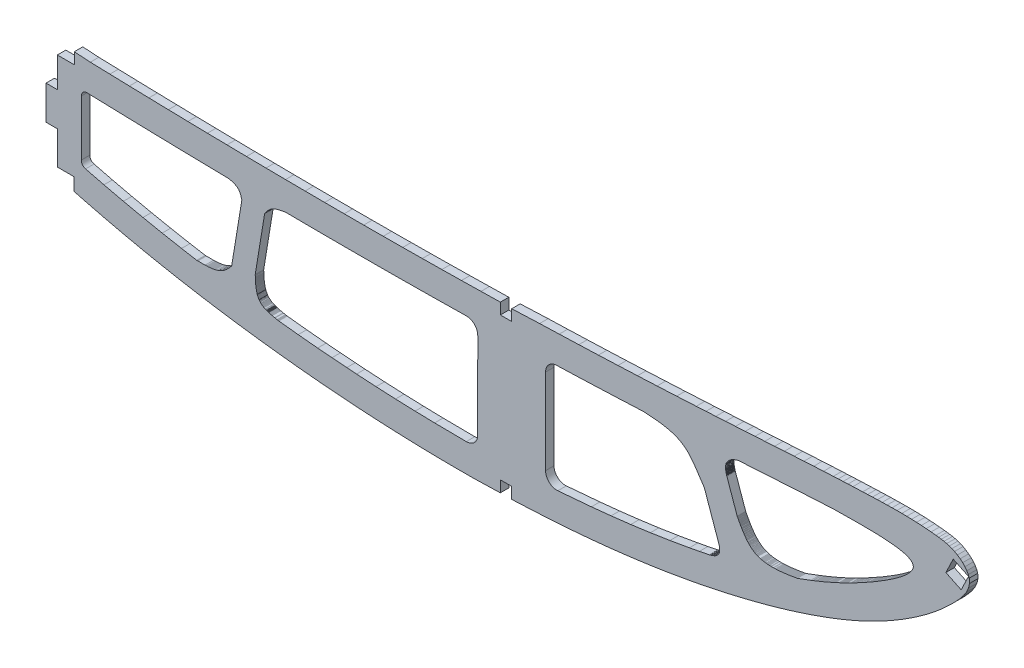
from build123d import *

# Parameters (mm, degrees)
EXTRUDE_1_DEPTH = 1.5


with BuildPart() as part:
    # Model → 凸台-拉伸1 (new body)
    with BuildSketch(Plane.XY):
        Polygon((54.716285757, 305.174370255), (56.53702023, 304.693003988), (59.966753915, 303.839995286), (63.409680865, 303.036453115), (66.864890209, 302.284419612), (70.273836005, 301.595486697), (73.690935845, 300.95524168), (77.116145651, 300.362685535), (80.549421343, 299.816819234), (83.989675736, 299.315688798), (87.436820671, 298.857296173), (90.889813041, 298.44068641), (94.326718307, 298.067828276), (97.765342659, 297.733932236), (101.208815418, 297.441863137), (104.654095421, 297.190754187), (108.102225774, 296.981560336), (111.553250557, 296.815280612), (115.007125691, 296.690915987), (118.466892339, 296.609333251), (121.927599439, 296.571751828), (125.386249909, 296.578303955), (130.088896684, 296.707406003), (130.089817018, 298.707405792), (132.089816806, 298.706485457), (132.088896472, 296.706485669), (135.761556104, 296.878261218), (139.218591324, 297.075069465), (142.713927747, 297.32323935), (146.203608138, 297.624710354), (149.687764735, 297.982479562), (153.164399482, 298.396635131), (156.633732775, 298.872172202), (160.092811608, 299.41022204), (163.542767246, 300.01373765), (165.300191585, 300.347596443), (167.053414208, 300.699658135), (168.803434142, 301.069878649), (170.549252361, 301.458302063), (172.289869835, 301.864972456), (174.0273287, 302.290800699), (175.760629928, 302.73583087), (177.53434786, 303.212109882), (179.302042336, 303.710676064), (181.062714329, 304.231573495), (182.816496075, 304.777799261), (184.562344467, 305.348398412), (186.299436794, 305.947411139), (188.026774028, 306.574881522), (188.919539447, 306.912857713), (189.808617308, 307.258003417), (190.693096741, 307.612360769), (191.574020853, 307.976884718), (192.451345565, 308.350576236), (193.322117871, 308.734566588), (194.188335828, 309.128767616), (195.08997535, 309.55443788), (195.986149652, 309.992360954), (196.875947866, 310.444578976), (197.759281833, 310.909093887), (198.638237767, 311.387815587), (199.511816641, 311.880788154), (200.38110564, 312.389965565), (201.313980096, 312.956395833), (202.238612645, 313.54020629), (203.151873965, 314.138532088), (204.049767944, 314.751549545), (204.929253419, 315.37839187), (205.786202039, 316.016238295), (206.617616722, 316.665221057), (207.115927884, 317.06964903), (207.606511297, 317.480423804), (208.093583468, 317.902364203), (208.581228668, 318.337291966), (209.071709426, 318.791113105), (209.571108071, 319.265561199), (210.081554894, 319.763545175), (210.76692067, 320.460011795), (211.435934868, 321.194235877), (212.045154412, 321.957123514), (212.553134283, 322.739492642), (212.916387325, 323.531250324), (213.092469489, 324.323258576), (213.038936729, 325.106379412), (212.873878774, 325.585120335), (212.616116816, 326.049934032), (212.563687797, 326.119338458), (212.281326748, 326.49312204), (211.881188354, 326.907162214), (211.432420636, 327.285311041), (210.946747455, 327.621045403), (210.440843735, 327.906622758), (209.982540433, 328.114025948), (209.519520961, 328.282599281), (209.052049794, 328.418336926), (208.580303249, 328.525234995), (208.106587935, 328.610198526), (207.629126193, 328.678310817), (207.150224631, 328.736476908), (206.294351655, 328.826290323), (205.435775358, 328.900207448), (204.574583896, 328.960226339), (203.711820379, 329.007301944), (202.846485777, 329.041478342), (201.981621253, 329.063622325), (201.117314966, 329.075731949), (200.250569833, 329.07793945), (199.385426043, 329.071067541), (198.51992962, 329.056203407), (197.655167751, 329.035301026), (196.791184514, 329.009359426), (195.92706904, 328.980420742), (195.062821329, 328.948484973), (194.196575561, 328.916637363), (193.331196585, 328.881748589), (192.465817608, 328.846859815), (191.599351445, 328.810017065), (190.733840231, 328.772131207), (189.868284937, 328.733246321), (189.002597407, 328.691364351), (187.269092052, 328.604691485), (185.536277172, 328.510981344), (183.803285975, 328.413275091), (182.071161569, 328.312527674), (180.339903954, 328.208739094), (178.607603231, 328.103995566), (176.87525843, 327.998253009), (175.142002758, 327.894552587), (173.409746115, 327.790808086), (171.67757763, 327.689061642), (169.945453224, 327.588314225), (168.212417948, 327.489608944), (166.480469858, 327.392857639), (164.746611871, 327.298192549), (161.28419959, 327.11563517), (157.8222281, 326.943068071), (154.359698373, 326.780535331), (150.897565358, 326.626993844), (147.434918186, 326.484485744), (143.970757828, 326.353055111), (140.505084283, 326.232701945), (137.044934829, 326.12411672), (133.10179698, 325.960272302), (132.102338993, 325.918743038), (132.101437981, 323.960732423), (130.101438193, 323.961652757), (130.102345699, 325.933775581), (126.668394714, 325.864252816), (123.209229791, 325.800667932), (119.748507603, 325.747161487), (116.287315337, 325.705687457), (112.829649104, 325.676069526), (109.37342269, 325.656397797), (105.917637068, 325.646716348), (102.462336315, 325.648024208), (99.006433247, 325.658367399), (95.549927863, 325.677745922), (92.092820162, 325.706159776), (88.63806315, 325.742477696), (85.183702851, 325.787786869), (81.730650133, 325.840045159), (78.2769951, 325.90133878), (74.824691727, 325.970580547), (71.370698852, 326.046903668), (67.91701453, 326.130219985), (64.463682842, 326.221528527), (61.012657763, 326.319742107), (57.560854052, 326.422994906), (54.726148508, 326.607344837), (54.725228174, 324.607345049), (51.725228492, 324.60872555), (51.722785047, 319.298819399), (49.722785259, 319.299739733), (49.720024256, 313.299740368), (51.720024045, 313.298820034), (51.717326022, 307.43568468), (54.717325705, 307.434304178), align=None)
        Polygon((189.000438687, 323.689577496), (187.266791217, 323.604692015), (185.533976336, 323.510981874), (183.80098514, 323.41327562), (182.934922937, 323.362901912), (181.783536017, 323.295423039), (180.337603118, 323.208739624), (178.605302396, 323.103996095), (176.872957594, 322.998253538), (175.139701923, 322.894553116), (173.407445279, 322.790808616), (172.139989509, 322.717336018), (172.10998491, 322.707349824), (172.089980311, 322.697359028), (172.069980313, 322.697368231), (172.039975714, 322.687382037), (172.019971115, 322.677391242), (171.999966515, 322.667400446), (171.979961916, 322.657409651), (171.949961919, 322.657423456), (171.929957319, 322.64743266), (171.90995272, 322.637441864), (171.88994812, 322.627451069), (171.859948123, 322.627464874), (171.839943524, 322.617474078), (171.819938924, 322.607483283), (171.799934325, 322.597492487), (171.769929726, 322.587506293), (171.749925127, 322.577515498), (171.729925129, 322.577524701), (171.709920529, 322.567533905), (171.679915931, 322.557547711), (171.659911331, 322.547556916), (171.639906732, 322.53756612), (171.619902132, 322.527575325), (171.589902135, 322.52758913), (171.569897536, 322.517598334), (171.549892936, 322.507607538), (171.529888337, 322.497616743), (171.509883737, 322.487625947), (171.479879139, 322.477639753), (171.459874539, 322.467648958), (171.439869939, 322.457658162), (171.41986534, 322.447667366), (171.39986074, 322.437676571), (171.369856142, 322.427690377), (171.349851542, 322.417699581), (171.329846943, 322.407708786), (171.309842343, 322.39771799), (171.289837744, 322.387727195), (171.269833144, 322.377736399), (171.239828546, 322.367750205), (171.219823946, 322.357759409), (171.199819346, 322.347768614), (171.179814747, 322.337777818), (171.159810147, 322.327787023), (171.139805548, 322.317796227), (171.119800948, 322.307805431), (171.099796349, 322.297814636), (171.079791749, 322.28782384), (171.059782548, 322.267833046), (171.029777949, 322.257846852), (171.00977335, 322.247856056), (170.98976875, 322.237865261), (170.969759549, 322.217874466), (170.94975495, 322.20788367), (170.92975035, 322.197892875), (170.90974575, 322.187902079), (170.889736549, 322.167911285), (170.86973195, 322.157920489), (170.84972735, 322.147929693), (170.829718149, 322.127938899), (170.809713549, 322.117948103), (170.789704348, 322.097957309), (170.769699749, 322.087966513), (170.749690547, 322.067975719), (170.729685948, 322.057984923), (170.709676747, 322.037994129), (170.699672146, 322.027998731), (170.679662945, 322.008007937), (170.659658345, 321.998017141), (170.639649144, 321.978026347), (170.619644544, 321.968035551), (170.599635343, 321.948044756), (170.579626142, 321.928053962), (170.569621541, 321.918058565), (170.54961234, 321.89806777), (170.529603139, 321.878076976), (170.509598539, 321.86808618), (170.489589338, 321.848095385), (170.479580136, 321.828099989), (170.459570935, 321.808109195), (170.439566335, 321.798118399), (170.429557133, 321.778123003), (170.409547932, 321.758132208), (170.38953873, 321.738141414), (170.379529528, 321.718146018), (170.359520327, 321.698155223), (170.349511125, 321.678159827), (170.329506525, 321.668169031), (170.309497324, 321.648178237), (170.299488121, 321.62818284), (170.27947892, 321.608192046), (170.269469718, 321.58819665), (170.259460516, 321.568201253), (170.239451314, 321.548210459), (170.229442112, 321.528215063), (170.209432911, 321.508224268), (170.199423709, 321.488228872), (170.189414506, 321.468233476), (170.169405305, 321.448242681), (170.159396103, 321.428247285), (170.149386901, 321.408251889), (170.139377698, 321.388256493), (170.129363894, 321.358261097), (170.109354693, 321.338270303), (170.099345491, 321.318274907), (170.089336289, 321.29827951), (170.079327086, 321.278284114), (170.069317884, 321.258288718), (170.059308682, 321.238293322), (170.049299479, 321.218297926), (170.039285675, 321.18830253), (170.029276473, 321.168307134), (170.02926727, 321.148307136), (170.019258068, 321.12831174), (170.009248865, 321.108316344), (169.999235061, 321.078320949), (169.999225858, 321.058320951), (169.989216656, 321.038325555), (169.979207453, 321.018330158), (169.97919825, 320.998330161), (169.969184446, 320.968334765), (169.969175243, 320.948334768), (169.95916604, 320.928339371), (169.959156837, 320.908339373), (169.949143033, 320.878343978), (169.94913383, 320.85834398), (169.939124628, 320.838348584), (169.939115424, 320.818348586), (169.939101619, 320.78834859), (169.929092417, 320.768353193), (169.929083214, 320.748353195), (169.929069409, 320.718353199), (169.929060205, 320.698353201), (169.929051002, 320.678353203), (169.929041799, 320.658353205), (169.919027995, 320.62835781), (169.919018791, 320.608357812), (169.919009588, 320.588357814), (169.918995783, 320.558357817), (169.91898658, 320.538357819), (169.918977376, 320.518357821), (169.918963571, 320.488357825), (169.928954367, 320.468353225), (169.928945163, 320.448353227), (169.928931358, 320.41835323), (169.928922155, 320.398353232), (169.92890835, 320.368353236), (169.928899147, 320.348353238), (169.938889942, 320.328348638), (169.938876137, 320.298348641), (169.938866934, 320.278348644), (169.938857731, 320.258348646), (169.948843925, 320.228344047), (169.948834721, 320.208344049), (169.948820916, 320.178344052), (169.958811712, 320.158339453), (169.958802508, 320.138339455), (169.958788703, 320.108339458), (169.968779499, 320.088334859), (169.968765694, 320.058334862), (169.97875649, 320.038330262), (169.978747286, 320.018330264), (169.98873348, 319.988325666), (169.988724277, 319.968325668), (169.998710471, 319.938321069), (169.998701267, 319.918321072), (170.008687461, 319.888316473), (170.008678258, 319.868316475), (170.018669054, 319.848311876), (170.018655249, 319.818311879), (170.028646044, 319.798307279), (170.028632239, 319.768307282), (170.038623035, 319.748302683), (170.048609229, 319.718298084), (170.048600025, 319.698298087), (170.058590821, 319.678293487), (170.058577016, 319.64829349), (170.068567812, 319.628288891), (170.078554006, 319.598284292), (170.078544802, 319.578284294), (170.088530996, 319.548279696), (170.098521792, 319.528275096), (170.098507987, 319.498275099), (170.108498782, 319.4782705), (170.118489578, 319.4582659), (170.118475773, 319.428265903), (170.128466568, 319.408261304), (170.138452762, 319.378256705), (170.138443559, 319.358256708), (170.148429753, 319.328252109), (170.158420549, 319.308247509), (171.99601368, 314.077401356), (172.025986067, 314.017387557), (172.055953852, 313.947373759), (172.095926237, 313.887355359), (172.125898624, 313.82734156), (172.165866408, 313.757323161), (172.195838795, 313.697309363), (172.225811182, 313.637295564), (172.265778966, 313.567277165), (172.295751353, 313.507263366), (172.335723739, 313.447244966), (172.365691524, 313.377231168), (172.405663909, 313.317212768), (172.435636296, 313.257198969), (172.47560408, 313.18718057), (172.505576467, 313.127166771), (172.535548854, 313.067152972), (172.57552124, 313.007134572), (172.605493626, 312.947120773), (172.64546141, 312.877102374), (172.675433797, 312.817088575), (172.715406183, 312.757070175), (172.755378569, 312.697051775), (172.785350956, 312.637037976), (172.825323341, 312.577019576), (172.855295728, 312.517005777), (172.895268114, 312.456987377), (172.9352405, 312.396968977), (172.965212886, 312.336955178), (173.005185272, 312.276936778), (173.045157658, 312.216918377), (173.075130045, 312.156904579), (173.115107032, 312.106886177), (173.155079418, 312.046867777), (173.195051803, 311.986849376), (173.22502419, 311.926835578), (173.265001178, 311.876817176), (173.304973563, 311.816798776), (173.344945949, 311.756780376), (173.384922937, 311.706761974), (173.424895322, 311.646743574), (173.46487231, 311.596725173), (173.504849297, 311.546706771), (173.544821683, 311.486688371), (173.58479867, 311.43666997), (173.624775658, 311.386651568), (173.664748043, 311.326633168), (173.704725031, 311.276614766), (173.754702017, 311.226591763), (173.794679005, 311.176573362), (173.834655992, 311.126554961), (173.874632979, 311.076536559), (173.924609966, 311.026513556), (173.964586953, 310.976495155), (174.004568542, 310.936476752), (174.054545529, 310.886453749), (174.094522516, 310.836435348), (174.144504104, 310.796412344), (174.184481091, 310.746393942), (174.234462679, 310.706370938), (174.284439666, 310.656347935), (174.324421255, 310.616329533), (174.374402843, 310.576306529), (174.424384431, 310.536283524), (174.474361417, 310.486260521), (174.524343005, 310.446237517), (174.574324593, 310.406214513), (174.614306182, 310.366196111), (174.664292372, 310.336173106), (174.724273959, 310.2961455), (174.774255547, 310.256122496), (174.824241737, 310.22609949), (174.874223325, 310.186076486), (174.924209515, 310.156053481), (174.984191101, 310.116025875), (175.034177291, 310.08600287), (175.084163481, 310.055979865), (175.144149669, 310.025952258), (175.194135859, 309.995929253), (175.254122048, 309.965901646), (175.314108236, 309.935874039), (175.364094426, 309.905851034), (175.424080615, 309.875823427), (175.484071405, 309.855795819), (175.544057594, 309.825768212), (175.604048384, 309.805740605), (175.664034573, 309.775712998), (175.724025363, 309.75568539), (175.784016153, 309.735657782), (175.844006944, 309.715630174), (175.903997734, 309.695602566), (175.963988524, 309.675574958), (176.023979314, 309.65554735), (176.083970105, 309.635519742), (176.153965496, 309.625487532), (176.213956286, 309.605459924), (176.283947075, 309.585427714), (176.343942467, 309.575400105), (176.403933258, 309.555372497), (176.473928648, 309.545340287), (176.53392404, 309.535312678), (176.60391483, 309.515280468), (176.673910221, 309.505248257), (176.733905613, 309.495220649), (176.803901003, 309.485188438), (176.863896395, 309.475160829), (176.933891786, 309.465128618), (177.003887177, 309.455096408), (177.073882568, 309.445064197), (177.133882562, 309.445036587), (177.203877953, 309.435004376), (177.273873344, 309.424972166), (177.343873336, 309.424939954), (177.403868728, 309.414912345), (177.473868721, 309.414880133), (177.543864112, 309.404847923), (177.613864104, 309.404815711), (177.683859495, 309.3947835), (177.753859488, 309.394751289), (177.82385948, 309.394719077), (177.893859473, 309.394686865), (177.953859467, 309.394659255), (178.023854858, 309.384627045), (178.09385485, 309.384594833), (178.163854843, 309.384562621), (178.233854835, 309.38453041), (178.303854828, 309.384498198), (178.373854821, 309.384465986), (178.443859415, 309.394433773), (178.513859407, 309.394401562), (178.5838594, 309.39436935), (178.653859393, 309.394337138), (178.713859386, 309.394309528), (178.78386398, 309.404277315), (178.853863973, 309.404245104), (178.923863966, 309.404212892), (178.99386856, 309.414180679), (179.063868553, 309.414148468), (179.133868545, 309.414116256), (179.19387314, 309.424088645), (179.263873133, 309.424056433), (179.333877727, 309.43402422), (179.40387772, 309.433992009), (179.463882315, 309.443964398), (179.533882308, 309.443932186), (179.603886902, 309.453899973), (179.673891496, 309.46386776), (179.73389149, 309.46384015), (179.803896084, 309.473807938), (179.873896077, 309.473775726), (179.933900672, 309.483748115), (180.003905266, 309.493715902), (180.073909861, 309.503683689), (180.133909854, 309.503656079), (180.203914449, 309.513623867), (180.263919044, 309.523596255), (180.333923638, 309.533564043), (180.403923631, 309.533531831), (180.463928226, 309.54350422), (180.53393282, 309.553472007), (180.593937416, 309.563444396), (180.66394201, 309.573412183), (180.733946604, 309.583379971), (180.793951199, 309.593352359), (180.863955794, 309.603320147), (180.923955787, 309.603292537), (180.993960382, 309.613260324), (181.053964977, 309.623232713), (181.123969571, 309.6332005), (181.183974166, 309.643172889), (181.253978761, 309.653140676), (181.313983356, 309.663113065), (181.38398795, 309.673080852), (181.443992546, 309.683053241), (181.51399714, 309.693021029), (181.574001735, 309.702993417), (181.644006329, 309.712961205), (181.704010925, 309.722933594), (181.774015519, 309.732901381), (181.834020114, 309.74287377), (181.90402931, 309.762841556), (181.964033906, 309.772813945), (182.0340385, 309.782781732), (182.094043095, 309.792754121), (182.164047689, 309.802721908), (182.224052285, 309.812694297), (182.294056879, 309.822662084), (182.354061474, 309.832634473), (182.41406607, 309.842606862), (182.484070664, 309.85257465), (182.544075259, 309.862547038), (182.614079854, 309.872514826), (185.034498349, 310.781401125), (185.194525942, 310.841327492), (185.354553536, 310.901253859), (185.51458573, 310.971180225), (185.674613323, 311.031106592), (185.834640916, 311.091032958), (185.994673111, 311.160959324), (186.154700704, 311.220885691), (186.324732898, 311.290807455), (186.484765093, 311.360733821), (186.644792686, 311.420660188), (186.804824881, 311.490586554), (186.974857074, 311.560508318), (187.134889269, 311.630434684), (187.304916861, 311.690356449), (187.464949056, 311.760282815), (187.63498125, 311.830204579), (187.795018046, 311.910130944), (187.96505024, 311.980052708), (188.135082433, 312.049974472), (188.295114628, 312.119900838), (188.465151424, 312.199822601), (188.635183617, 312.269744366), (188.805220413, 312.349666129), (188.975252606, 312.419587893), (189.145289402, 312.499509656), (189.315321595, 312.56943142), (189.485358391, 312.649353183), (189.655395186, 312.729274946), (189.825431981, 312.80919671), (189.995468777, 312.889118473), (190.175505571, 312.969035634), (190.345542367, 313.048957397), (190.515583764, 313.138879159), (190.695620558, 313.218796321), (190.865661955, 313.308718083), (191.045698749, 313.388635244), (191.225740145, 313.478552405), (191.395776941, 313.558474168), (191.575818337, 313.648391328), (191.755859733, 313.738308489), (191.935901129, 313.828225649), (192.115942524, 313.918142809), (192.295988522, 314.018059969), (192.476029918, 314.107977129), (192.656071314, 314.197894289), (192.836117312, 314.297811449), (193.026158707, 314.387724008), (193.206204704, 314.487641167), (193.386250702, 314.587558326), (193.576296699, 314.687470884), (193.766342695, 314.787383441), (193.946388693, 314.887300601), (194.136434689, 314.987213158), (194.326480686, 315.087125716), (194.516531284, 315.197038273), (194.706577281, 315.29695083), (194.896627879, 315.406863387), (195.086678477, 315.516775944), (195.276729076, 315.6266885), (195.476779673, 315.736596455), (195.666830271, 315.846509012), (195.856880869, 315.956421568), (196.056931467, 316.066329523), (196.256986665, 316.186237477), (196.447041865, 316.306150033), (196.647092463, 316.416057988), (196.847147662, 316.535965942), (197.037202861, 316.655878497), (197.23725806, 316.775786451), (197.42731326, 316.895699006), (197.627368459, 317.01560696), (197.827423658, 317.135514914), (198.017478858, 317.25542747), (198.207534058, 317.375340025), (198.397589258, 317.495252581), (198.587649059, 317.625165135), (198.777704259, 317.745077691), (198.967759459, 317.864990246), (199.147819262, 317.994907403), (199.337874462, 318.114819958), (199.517929663, 318.234737115), (199.687984865, 318.354658874), (199.868044668, 318.48457603), (200.03809987, 318.604497789), (200.208155072, 318.724419548), (200.378210274, 318.844341307), (200.538265477, 318.964267668), (200.698325282, 319.094194027), (200.858380485, 319.214120388), (201.008431087, 319.324051351), (201.158486291, 319.443982313), (201.308541496, 319.563913275), (201.448596701, 319.683848839), (201.578647305, 319.793789006), (201.718702511, 319.91372457), (201.838753116, 320.023669338), (201.968808323, 320.143609504), (202.078858929, 320.253558874), (202.198909535, 320.363503642), (202.298960143, 320.473457614), (202.399006149, 320.573411586), (202.499056757, 320.683365558), (202.589107366, 320.793324131), (202.669153374, 320.893287307), (202.749199382, 320.993250483), (202.819245391, 321.093218261), (202.879291402, 321.19319064), (202.93933281, 321.283163021), (202.989378822, 321.383140002), (203.039420232, 321.473116984), (203.069461644, 321.56310317), (203.099503055, 321.653089355), (203.129539866, 321.733075542), (203.139576678, 321.813070931), (203.149618092, 321.90306632), (203.149650304, 321.973066313), (203.139687118, 322.053070906), (203.119723933, 322.133080101), (203.099756147, 322.203089297), (203.069788362, 322.273103094), (203.029820578, 322.343121494), (202.989848192, 322.403139894), (202.939880409, 322.473162895), (202.879908026, 322.533190499), (202.819935642, 322.593218102), (202.74996326, 322.653250308), (202.669986276, 322.703287116), (202.590013895, 322.763323923), (202.500036913, 322.813365332), (202.410059931, 322.863406742), (202.31008295, 322.913452754), (202.20010597, 322.963503367), (202.090124388, 323.003553981), (201.970142807, 323.043609197), (201.840165829, 323.093669013), (201.71018425, 323.133728831), (201.58020267, 323.173788648), (201.44021649, 323.203853068), (201.290234913, 323.243922089), (201.140248734, 323.273991111), (200.990267156, 323.314060132), (200.830280978, 323.344133755), (200.660294801, 323.374211981), (200.490304023, 323.394290207), (200.320317846, 323.424368432), (200.14033167, 323.454451259), (199.960340892, 323.474534087), (199.770350115, 323.494621517), (199.580363941, 323.524708945), (199.380373165, 323.544800977), (199.18038239, 323.564893008), (198.980387012, 323.57498504), (198.770396238, 323.595081673), (198.560405464, 323.615178306), (198.340410089, 323.625279542), (198.120419315, 323.645380777), (197.90042394, 323.655482012), (197.670428566, 323.66558785), (197.450433191, 323.675689085), (197.210437818, 323.685799524), (196.980442444, 323.695905362), (196.740447071, 323.706015801), (196.500447097, 323.706126241), (196.260451724, 323.71623668), (196.010456352, 323.726351721), (195.760456378, 323.726466762), (195.510461007, 323.736581803), (195.260461033, 323.736696845), (195.000461061, 323.736816488), (194.740461088, 323.736936132), (194.480465717, 323.747055774), (194.220465745, 323.747175418), (193.960465772, 323.747295061), (193.690465801, 323.747419306), (193.42046583, 323.747543551), (193.150465858, 323.747667796), (192.880461285, 323.737792043), (192.610461314, 323.737916288), (192.340461342, 323.738040533), (192.070461371, 323.738164778), (191.790456799, 323.728293626), (191.510456828, 323.728422473), (191.240456857, 323.728546718), (190.960452285, 323.718675566), (190.680452315, 323.718804412), (190.400447743, 323.70893326), (190.120447772, 323.709062107), (189.840447802, 323.709190954), (189.56044323, 323.699319802), (189.28044326, 323.699448648), align=None, mode=Mode.SUBTRACT)
        with BuildLine():
            Line((155.349577136, 321.825062319), (154.357397538, 321.78053586))
            Line((154.357397538, 321.78053586), (150.895264523, 321.626994373))
            Line((150.895264523, 321.626994373), (149.959602404, 321.588486427))
            Line((149.959602404, 321.588486427), (149.163940937, 321.555740323))
            Line((149.163940937, 321.555740323), (147.43261735, 321.484486274))
            Line((147.43261735, 321.484486274), (143.968456992, 321.353055641))
            Line((143.968456992, 321.353055641), (140.029843567, 321.216278593))
            ThreePointArc((140.029843567, 321.216278593), (138.661030572, 320.607270233), (138.099256353, 319.218403817))
            Line((138.099256353, 319.218403817), (138.092301628, 304.104929192))
            ThreePointArc((138.092301628, 304.104929192), (138.739977673, 302.630502667), (140.264438846, 302.111430451))
            Line((140.264438846, 302.111430451), (146.205908974, 302.624709825))
            Line((146.205908974, 302.624709825), (149.690065571, 302.982479032))
            Line((149.690065571, 302.982479032), (153.166700318, 303.396634602))
            Line((153.166700318, 303.396634602), (153.396940633, 303.428193347))
            Line((153.396940633, 303.428193347), (154.901366964, 303.634403137))
            Line((154.901366964, 303.634403137), (156.63603361, 303.872171673))
            Line((156.63603361, 303.872171673), (160.095112443, 304.410221511))
            Line((160.095112443, 304.410221511), (163.545068082, 305.013737121))
            Line((163.545068082, 305.013737121), (165.302492421, 305.347595913))
            Line((165.302492421, 305.347595913), (167.052158002, 305.699675468))
            Line((167.052158002, 305.699675468), (167.072158, 305.699666265))
            Line((167.072158, 305.699666265), (167.0921626, 305.709657061))
            Line((167.0921626, 305.709657061), (167.112162598, 305.709647857))
            Line((167.112162598, 305.709647857), (167.122167198, 305.719643255))
            Line((167.122167198, 305.719643255), (167.142167196, 305.719634051))
            Line((167.142167196, 305.719634051), (167.162171796, 305.729624847))
            Line((167.162171796, 305.729624847), (167.182171794, 305.729615644))
            Line((167.182171794, 305.729615644), (167.202176393, 305.739606439))
            Line((167.202176393, 305.739606439), (167.212176392, 305.739601838))
            Line((167.212176392, 305.739601838), (167.232180992, 305.749592633))
            Line((167.232180992, 305.749592633), (167.25218099, 305.74958343))
            Line((167.25218099, 305.74958343), (167.272185589, 305.759574225))
            Line((167.272185589, 305.759574225), (167.282185588, 305.759569624))
            Line((167.282185588, 305.759569624), (167.302190188, 305.769560419))
            Line((167.302190188, 305.769560419), (167.322190186, 305.769551216))
            Line((167.322190186, 305.769551216), (167.342194785, 305.779542012))
            Line((167.342194785, 305.779542012), (167.362194783, 305.779532808))
            Line((167.362194783, 305.779532808), (167.372199384, 305.789528205))
            Line((167.372199384, 305.789528205), (167.392199381, 305.789519002))
            Line((167.392199381, 305.789519002), (167.412203981, 305.799509798))
            Line((167.412203981, 305.799509798), (167.432203979, 305.799500594))
            Line((167.432203979, 305.799500594), (167.44220858, 305.809495992))
            Line((167.44220858, 305.809495992), (167.462208577, 305.809486788))
            Line((167.462208577, 305.809486788), (167.482213177, 305.819477584))
            Line((167.482213177, 305.819477584), (167.502213175, 305.819468381))
            Line((167.502213175, 305.819468381), (167.512217775, 305.829463778))
            Line((167.512217775, 305.829463778), (167.532217773, 305.829454575))
            Line((167.532217773, 305.829454575), (167.552222373, 305.83944537))
            Line((167.552222373, 305.83944537), (167.572226972, 305.849436166))
            Line((167.572226972, 305.849436166), (167.582226971, 305.849431564))
            Line((167.582226971, 305.849431564), (167.602231571, 305.85942236))
            Line((167.602231571, 305.85942236), (167.622231569, 305.859413156))
            Line((167.622231569, 305.859413156), (167.632236169, 305.869408554))
            Line((167.632236169, 305.869408554), (167.652240769, 305.879399349))
            Line((167.652240769, 305.879399349), (167.672240767, 305.879390146))
            Line((167.672240767, 305.879390146), (167.692245366, 305.889380941))
            Line((167.692245366, 305.889380941), (167.702245365, 305.88937634))
            Line((167.702245365, 305.88937634), (167.722249965, 305.899367135))
            Line((167.722249965, 305.899367135), (167.742254564, 305.909357931))
            Line((167.742254564, 305.909357931), (167.752254563, 305.909353329))
            Line((167.752254563, 305.909353329), (167.772259163, 305.919344125))
            Line((167.772259163, 305.919344125), (167.792263763, 305.92933492))
            Line((167.792263763, 305.92933492), (167.802263761, 305.929330319))
            Line((167.802263761, 305.929330319), (167.822268361, 305.939321114))
            Line((167.822268361, 305.939321114), (167.842272961, 305.94931191))
            Line((167.842272961, 305.94931191), (167.85227296, 305.949307308))
            Line((167.85227296, 305.949307308), (167.872277559, 305.959298104))
            Line((167.872277559, 305.959298104), (167.892282159, 305.9692889))
            Line((167.892282159, 305.9692889), (167.902282158, 305.969284298))
            Line((167.902282158, 305.969284298), (167.922286757, 305.979275093))
            Line((167.922286757, 305.979275093), (167.942291357, 305.989265889))
            Line((167.942291357, 305.989265889), (167.952295957, 305.999261286))
            Line((167.952295957, 305.999261286), (167.972295955, 305.999252083))
            Line((167.972295955, 305.999252083), (167.982300556, 306.00924748))
            Line((167.982300556, 306.00924748), (168.002305155, 306.019238276))
            Line((168.002305155, 306.019238276), (168.022309755, 306.029229071))
            Line((168.022309755, 306.029229071), (168.032314356, 306.039224469))
            Line((168.032314356, 306.039224469), (168.052318955, 306.049215264))
            Line((168.052318955, 306.049215264), (168.062318954, 306.049210663))
            Line((168.062318954, 306.049210663), (168.082323554, 306.059201458))
            Line((168.082323554, 306.059201458), (168.092328154, 306.069196856))
            Line((168.092328154, 306.069196856), (168.112332754, 306.079187651))
            Line((168.112332754, 306.079187651), (168.122337354, 306.089183048))
            Line((168.122337354, 306.089183048), (168.142341954, 306.099173844))
            Line((168.142341954, 306.099173844), (168.162346553, 306.10916464))
            Line((168.162346553, 306.10916464), (168.172351154, 306.119160037))
            Line((168.172351154, 306.119160037), (168.192355754, 306.129150832))
            Line((168.192355754, 306.129150832), (168.202360354, 306.13914623))
            Line((168.202360354, 306.13914623), (168.222364954, 306.149137025))
            Line((168.222364954, 306.149137025), (168.232369554, 306.159132423))
            Line((168.232369554, 306.159132423), (168.242374155, 306.16912782))
            Line((168.242374155, 306.16912782), (168.262378755, 306.179118615))
            Line((168.262378755, 306.179118615), (168.272383355, 306.189114013))
            Line((168.272383355, 306.189114013), (168.292387955, 306.199104808))
            Line((168.292387955, 306.199104808), (168.302392555, 306.209100206))
            Line((168.302392555, 306.209100206), (168.322397155, 306.219091001))
            Line((168.322397155, 306.219091001), (168.332401755, 306.229086398))
            Line((168.332401755, 306.229086398), (168.352406355, 306.239077194))
            Line((168.352406355, 306.239077194), (168.362410956, 306.249072591))
            Line((168.362410956, 306.249072591), (168.372415556, 306.259067989))
            Line((168.372415556, 306.259067989), (168.392424757, 306.279058783))
            Line((168.392424757, 306.279058783), (168.402429358, 306.28905418))
            Line((168.402429358, 306.28905418), (168.412433959, 306.299049578))
            Line((168.412433959, 306.299049578), (168.432438558, 306.309040373))
            Line((168.432438558, 306.309040373), (168.442443159, 306.319035771))
            Line((168.442443159, 306.319035771), (168.452452361, 306.339031167))
            Line((168.452452361, 306.339031167), (168.472456961, 306.349021962))
            Line((168.472456961, 306.349021962), (168.482461561, 306.35901736))
            Line((168.482461561, 306.35901736), (168.492470764, 306.379012756))
            Line((168.492470764, 306.379012756), (168.512475363, 306.389003551))
            Line((168.512475363, 306.389003551), (168.522479964, 306.398998949))
            Line((168.522479964, 306.398998949), (168.532489166, 306.418994345))
            Line((168.532489166, 306.418994345), (168.542493767, 306.428989742))
            Line((168.542493767, 306.428989742), (168.552498367, 306.438985139))
            Line((168.552498367, 306.438985139), (168.572507569, 306.458975934))
            Line((168.572507569, 306.458975934), (168.582512169, 306.468971331))
            Line((168.582512169, 306.468971331), (168.592521371, 306.488966727))
            Line((168.592521371, 306.488966727), (168.602525972, 306.498962125))
            Line((168.602525972, 306.498962125), (168.612530573, 306.508957522))
            Line((168.612530573, 306.508957522), (168.622539775, 306.528952918))
            Line((168.622539775, 306.528952918), (168.642544374, 306.538943714))
            Line((168.642544374, 306.538943714), (168.652553577, 306.55893911))
            Line((168.652553577, 306.55893911), (168.662558177, 306.568934507))
            Line((168.662558177, 306.568934507), (168.67256738, 306.588929904))
            Line((168.67256738, 306.588929904), (168.68257198, 306.598925301))
            Line((168.68257198, 306.598925301), (168.692581183, 306.618920697))
            Line((168.692581183, 306.618920697), (168.702585783, 306.628916094))
            Line((168.702585783, 306.628916094), (168.712594985, 306.64891149))
            Line((168.712594985, 306.64891149), (168.722604188, 306.668906887))
            Line((168.722604188, 306.668906887), (168.732608788, 306.678902284))
            Line((168.732608788, 306.678902284), (168.732617992, 306.698902282))
            Line((168.732617992, 306.698902282), (168.742622592, 306.708897679))
            Line((168.742622592, 306.708897679), (168.752631795, 306.728893075))
            Line((168.752631795, 306.728893075), (168.762636395, 306.738888473))
            Line((168.762636395, 306.738888473), (168.772645597, 306.758883869))
            Line((168.772645597, 306.758883869), (168.7826548, 306.778879265))
            Line((168.7826548, 306.778879265), (168.782659401, 306.788879264))
            Line((168.782659401, 306.788879264), (168.792668604, 306.80887466))
            Line((168.792668604, 306.80887466), (168.802677806, 306.828870056))
            Line((168.802677806, 306.828870056), (168.812682407, 306.838865454))
            Line((168.812682407, 306.838865454), (168.81269161, 306.858865452))
            Line((168.81269161, 306.858865452), (168.822700812, 306.878860848))
            Line((168.822700812, 306.878860848), (168.822705414, 306.888860847))
            Line((168.822705414, 306.888860847), (168.832714616, 306.908856243))
            Line((168.832714616, 306.908856243), (168.842723818, 306.928851639))
            Line((168.842723818, 306.928851639), (168.84272842, 306.938851638))
            Line((168.84272842, 306.938851638), (168.852737622, 306.958847034))
            Line((168.852737622, 306.958847034), (168.852746826, 306.978847032))
            Line((168.852746826, 306.978847032), (168.862751426, 306.988842429))
            Line((168.862751426, 306.988842429), (168.86276063, 307.008842427))
            Line((168.86276063, 307.008842427), (168.862769833, 307.028842425))
            Line((168.862769833, 307.028842425), (168.872774434, 307.038837822))
            Line((168.872774434, 307.038837822), (168.872783637, 307.05883782))
            Line((168.872783637, 307.05883782), (168.87279284, 307.078837818))
            Line((168.87279284, 307.078837818), (168.882802043, 307.098833214))
            Line((168.882802043, 307.098833214), (168.882806644, 307.108833213))
            Line((168.882806644, 307.108833213), (168.882815848, 307.128833211))
            Line((168.882815848, 307.128833211), (168.89282505, 307.148828607))
            Line((168.89282505, 307.148828607), (168.892834253, 307.168828605))
            Line((168.892834253, 307.168828605), (168.892838855, 307.178828604))
            Line((168.892838855, 307.178828604), (168.892848058, 307.198828602))
            Line((168.892848058, 307.198828602), (168.892857262, 307.2188286))
            Line((168.892857262, 307.2188286), (168.892866465, 307.238828598))
            Line((168.892866465, 307.238828598), (168.902871066, 307.248823995))
            Line((168.902871066, 307.248823995), (168.902880269, 307.268823993))
            Line((168.902880269, 307.268823993), (168.902889472, 307.288823991))
            Line((168.902889472, 307.288823991), (168.902898676, 307.308823989))
            Line((168.902898676, 307.308823989), (168.902903277, 307.318823988))
            Line((168.902903277, 307.318823988), (168.902912481, 307.338823986))
            Line((168.902912481, 307.338823986), (168.902921684, 307.358823984))
            Line((168.902921684, 307.358823984), (168.902930887, 307.378823981))
            Line((168.902930887, 307.378823981), (168.902935489, 307.38882398))
            Line((168.902935489, 307.38882398), (168.902944692, 307.408823978))
            Line((168.902944692, 307.408823978), (168.902953896, 307.428823976))
            Line((168.902953896, 307.428823976), (168.8929631, 307.448828576))
            Line((168.8929631, 307.448828576), (168.892972303, 307.468828574))
            Line((168.892972303, 307.468828574), (168.892976905, 307.478828573))
            Line((168.892976905, 307.478828573), (168.892986108, 307.49882857))
            Line((168.892986108, 307.49882857), (168.892995312, 307.518828568))
            Line((168.892995312, 307.518828568), (168.893004515, 307.538828566))
            Line((168.893004515, 307.538828566), (168.893013718, 307.558828564))
            Line((168.893013718, 307.558828564), (168.883018321, 307.568833165))
            Line((168.883018321, 307.568833165), (168.883027525, 307.588833163))
            Line((168.883027525, 307.588833163), (168.883036728, 307.60883316))
            Line((168.883036728, 307.60883316), (168.883045931, 307.628833158))
            Line((168.883045931, 307.628833158), (168.883055135, 307.648833156))
            Line((168.883055135, 307.648833156), (168.873064339, 307.668837756))
            Line((168.873064339, 307.668837756), (168.873068941, 307.678837755))
            Line((168.873068941, 307.678837755), (168.873078144, 307.698837753))
            Line((168.873078144, 307.698837753), (168.873087347, 307.71883775))
            Line((168.873087347, 307.71883775), (168.863096552, 307.73884235))
            Line((168.863096552, 307.73884235), (168.863105755, 307.758842348))
            Line((168.863105755, 307.758842348), (168.863114958, 307.778842346))
            Line((168.863114958, 307.778842346), (168.853119561, 307.788846946))
            Line((168.853119561, 307.788846946), (168.853128764, 307.808846944))
            Line((168.853128764, 307.808846944), (168.853137968, 307.828846942))
            Line((168.853137968, 307.828846942), (168.843147172, 307.848851542))
            Line((168.843147172, 307.848851542), (168.843156376, 307.86885154))
            Line((168.843156376, 307.86885154), (168.843165579, 307.888851537))
            Line((168.843165579, 307.888851537), (168.833170182, 307.898856138))
            Line((168.833170182, 307.898856138), (168.833179385, 307.918856136))
            Line((168.833179385, 307.918856136), (168.833188588, 307.938856134))
            Line((168.833188588, 307.938856134), (168.823197793, 307.958860733))
            Line((168.823197793, 307.958860733), (168.823206996, 307.978860731))
            Line((168.823206996, 307.978860731), (168.823216199, 307.998860729))
            Line((168.823216199, 307.998860729), (168.813220802, 308.00886533))
            Line((168.813220802, 308.00886533), (168.813230005, 308.028865328))
            Line((168.813230005, 308.028865328), (168.813239209, 308.048865326))
            Line((168.813239209, 308.048865326), (168.803248413, 308.068869925))
            Line((168.803248413, 308.068869925), (168.803257617, 308.088869923))
            Line((168.803257617, 308.088869923), (168.793266821, 308.108874523))
            Line((168.793266821, 308.108874523), (166.176690742, 315.550079373))
            Line((166.176690742, 315.550079373), (166.136718356, 315.610097773))
            Line((166.136718356, 315.610097773), (166.106745969, 315.670111572))
            Line((166.106745969, 315.670111572), (166.066768982, 315.720129973))
            Line((166.066768982, 315.720129973), (166.026796596, 315.780148373))
            Line((166.026796596, 315.780148373), (165.98682421, 315.840166774))
            Line((165.98682421, 315.840166774), (165.946851824, 315.900185174))
            Line((165.946851824, 315.900185174), (165.916874836, 315.950198974))
            Line((165.916874836, 315.950198974), (165.87690245, 316.010217374))
            Line((165.87690245, 316.010217374), (165.836930065, 316.070235774))
            Line((165.836930065, 316.070235774), (165.796953077, 316.120254176))
            Line((165.796953077, 316.120254176), (165.756980691, 316.180272576))
            Line((165.756980691, 316.180272576), (165.717008306, 316.240290976))
            Line((165.717008306, 316.240290976), (165.687035919, 316.300304775))
            Line((165.687035919, 316.300304775), (165.647058931, 316.350323177))
            Line((165.647058931, 316.350323177), (165.607086546, 316.410341577))
            Line((165.607086546, 316.410341577), (165.56711416, 316.470359977))
            Line((165.56711416, 316.470359977), (165.527141774, 316.530378378))
            Line((165.527141774, 316.530378378), (165.487164787, 316.580396779))
            Line((165.487164787, 316.580396779), (165.447192401, 316.640415179))
            Line((165.447192401, 316.640415179), (165.417220014, 316.700428978))
            Line((165.417220014, 316.700428978), (165.377247629, 316.760447378))
            Line((165.377247629, 316.760447378), (165.337270641, 316.81046578))
            Line((165.337270641, 316.81046578), (165.297298255, 316.87048418))
            Line((165.297298255, 316.87048418), (165.25732587, 316.93050258))
            Line((165.25732587, 316.93050258), (165.217353484, 316.990520981))
            Line((165.217353484, 316.990520981), (165.177376497, 317.040539382))
            Line((165.177376497, 317.040539382), (165.137404111, 317.100557782))
            Line((165.137404111, 317.100557782), (165.097431725, 317.160576183))
            Line((165.097431725, 317.160576183), (165.057459339, 317.220594583))
            Line((165.057459339, 317.220594583), (165.027482351, 317.270608383))
            Line((165.027482351, 317.270608383), (164.987509965, 317.330626783))
            Line((164.987509965, 317.330626783), (164.947537579, 317.390645183))
            Line((164.947537579, 317.390645183), (164.907565194, 317.450663584))
            Line((164.907565194, 317.450663584), (164.867592808, 317.510681984))
            Line((164.867592808, 317.510681984), (164.82761582, 317.560700385))
            Line((164.82761582, 317.560700385), (164.787643435, 317.620718786))
            Line((164.787643435, 317.620718786), (164.747671049, 317.680737186))
            Line((164.747671049, 317.680737186), (164.707698663, 317.740755586))
            Line((164.707698663, 317.740755586), (164.667726278, 317.800773987))
            Line((164.667726278, 317.800773987), (164.62774929, 317.850792388))
            Line((164.62774929, 317.850792388), (164.587776904, 317.910810788))
            Line((164.587776904, 317.910810788), (164.547804519, 317.970829189))
            Line((164.547804519, 317.970829189), (164.507832133, 318.030847589))
            Line((164.507832133, 318.030847589), (164.467859747, 318.090865989))
            Line((164.467859747, 318.090865989), (164.417882761, 318.140888993))
            Line((164.417882761, 318.140888993), (164.377910375, 318.200907393))
            Line((164.377910375, 318.200907393), (164.337937989, 318.260925793))
            Line((164.337937989, 318.260925793), (164.297961002, 318.310944195))
            Line((164.297961002, 318.310944195), (164.257988616, 318.370962595))
            Line((164.257988616, 318.370962595), (164.21801623, 318.430980995))
            Line((164.21801623, 318.430980995), (164.168039244, 318.481003998))
            Line((164.168039244, 318.481003998), (164.128066858, 318.541022399))
            Line((164.128066858, 318.541022399), (164.088089871, 318.5910408))
            Line((164.088089871, 318.5910408), (164.048117485, 318.6510592))
            Line((164.048117485, 318.6510592), (163.998145101, 318.711082202))
            Line((163.998145101, 318.711082202), (163.958168113, 318.761100604))
            Line((163.958168113, 318.761100604), (163.918191126, 318.811119005))
            Line((163.918191126, 318.811119005), (163.868218741, 318.871142007))
            Line((163.868218741, 318.871142007), (163.828241754, 318.921160409))
            Line((163.828241754, 318.921160409), (163.778269369, 318.981183411))
            Line((163.778269369, 318.981183411), (163.738292382, 319.031201812))
            Line((163.738292382, 319.031201812), (163.688315395, 319.081224815))
            Line((163.688315395, 319.081224815), (163.648338408, 319.131243216))
            Line((163.648338408, 319.131243216), (163.598366023, 319.191266218))
            Line((163.598366023, 319.191266218), (163.558389036, 319.24128462))
            Line((163.558389036, 319.24128462), (163.508412049, 319.291307623))
            Line((163.508412049, 319.291307623), (163.458435063, 319.341330626))
            Line((163.458435063, 319.341330626), (163.418458076, 319.391349027))
            Line((163.418458076, 319.391349027), (163.368481089, 319.44137203))
            Line((163.368481089, 319.44137203), (163.318504103, 319.491395033))
            Line((163.318504103, 319.491395033), (163.268522515, 319.531418038))
            Line((163.268522515, 319.531418038), (163.228545527, 319.581436439))
            Line((163.228545527, 319.581436439), (163.178568541, 319.631459442))
            Line((163.178568541, 319.631459442), (163.128586953, 319.671482446))
            Line((163.128586953, 319.671482446), (163.078609967, 319.721505449))
            Line((163.078609967, 319.721505449), (163.02863298, 319.771528452))
            Line((163.02863298, 319.771528452), (162.978651392, 319.811551456))
            Line((162.978651392, 319.811551456), (162.928669804, 319.85157446))
            Line((162.928669804, 319.85157446), (162.878692818, 319.901597464))
            Line((162.878692818, 319.901597464), (162.818711231, 319.941625069))
            Line((162.818711231, 319.941625069), (162.768729643, 319.981648073))
            Line((162.768729643, 319.981648073), (162.718748055, 320.021671078))
            Line((162.718748055, 320.021671078), (162.668766467, 320.061694082))
            Line((162.668766467, 320.061694082), (162.60878488, 320.101721687))
            Line((162.60878488, 320.101721687), (162.558803292, 320.141744692))
            Line((162.558803292, 320.141744692), (162.508821704, 320.181767696))
            Line((162.508821704, 320.181767696), (162.448840117, 320.221795302))
            Line((162.448840117, 320.221795302), (162.398853927, 320.251818307))
            Line((162.398853927, 320.251818307), (162.33887234, 320.291845912))
            Line((162.33887234, 320.291845912), (162.288890752, 320.331868917))
            Line((162.288890752, 320.331868917), (162.228904564, 320.361896523))
            Line((162.228904564, 320.361896523), (162.168922977, 320.401924129))
            Line((162.168922977, 320.401924129), (162.118936787, 320.431947134))
            Line((162.118936787, 320.431947134), (162.058950598, 320.461974741))
            Line((162.058950598, 320.461974741), (161.998969011, 320.502002347))
            Line((161.998969011, 320.502002347), (161.938982823, 320.532029954))
            Line((161.938982823, 320.532029954), (161.888996633, 320.562052959))
            Line((161.888996633, 320.562052959), (161.829010444, 320.592080566))
            Line((161.829010444, 320.592080566), (161.769024256, 320.622108173))
            Line((161.769024256, 320.622108173), (161.709038067, 320.65213578))
            Line((161.709038067, 320.65213578), (161.649051879, 320.682163387))
            Line((161.649051879, 320.682163387), (161.58906569, 320.712190993))
            Line((161.58906569, 320.712190993), (161.529079501, 320.7422186))
            Line((161.529079501, 320.7422186), (161.469093313, 320.772246207))
            Line((161.469093313, 320.772246207), (161.409107124, 320.802273814))
            Line((161.409107124, 320.802273814), (161.349116334, 320.822301422))
            Line((161.349116334, 320.822301422), (161.279130146, 320.85233363))
            Line((161.279130146, 320.85233363), (161.219139356, 320.872361238))
            Line((161.219139356, 320.872361238), (161.159153167, 320.902388845))
            Line((161.159153167, 320.902388845), (161.099162377, 320.922416453))
            Line((161.099162377, 320.922416453), (161.039176188, 320.95244406))
            Line((161.039176188, 320.95244406), (160.969185399, 320.972476269))
            Line((160.969185399, 320.972476269), (160.909194609, 320.992503877))
            Line((160.909194609, 320.992503877), (160.84920842, 321.022531484))
            Line((160.84920842, 321.022531484), (160.779217631, 321.042563694))
            Line((160.779217631, 321.042563694), (160.719226841, 321.062591302))
            Line((160.719226841, 321.062591302), (160.649236051, 321.082623511))
            Line((160.649236051, 321.082623511), (160.589245261, 321.102651119))
            Line((160.589245261, 321.102651119), (160.519254472, 321.122683329))
            Line((160.519254472, 321.122683329), (160.459263681, 321.142710937))
            Line((160.459263681, 321.142710937), (160.389272892, 321.162743146))
            Line((160.389272892, 321.162743146), (160.329282102, 321.182770754))
            Line((160.329282102, 321.182770754), (160.259291313, 321.202802964))
            Line((160.259291313, 321.202802964), (160.189300523, 321.222835173))
            Line((160.189300523, 321.222835173), (160.129309733, 321.242862781))
            Line((160.129309733, 321.242862781), (160.059318944, 321.262894991))
            Line((160.059318944, 321.262894991), (159.989323553, 321.272927201))
            Line((159.989323553, 321.272927201), (159.919332764, 321.292959411))
            Line((159.919332764, 321.292959411), (159.859341973, 321.312987019))
            Line((159.859341973, 321.312987019), (159.789346582, 321.32301923))
            Line((159.789346582, 321.32301923), (159.719355793, 321.343051439))
            Line((159.719355793, 321.343051439), (159.649360402, 321.35308365))
            Line((159.649360402, 321.35308365), (159.579369613, 321.373115859))
            Line((159.579369613, 321.373115859), (159.509374222, 321.38314807))
            Line((159.509374222, 321.38314807), (159.449383432, 321.403175678))
            Line((159.449383432, 321.403175678), (159.379388041, 321.413207889))
            Line((159.379388041, 321.413207889), (159.30939265, 321.423240099))
            Line((159.30939265, 321.423240099), (159.239401861, 321.443272309))
            Line((159.239401861, 321.443272309), (159.16940647, 321.453304519))
            Line((159.16940647, 321.453304519), (159.099411079, 321.46333673))
            Line((159.099411079, 321.46333673), (159.029415688, 321.473368941))
            Line((159.029415688, 321.473368941), (158.959424899, 321.49340115))
            Line((158.959424899, 321.49340115), (158.889429508, 321.503433361))
            Line((158.889429508, 321.503433361), (158.819434117, 321.513465572))
            Line((158.819434117, 321.513465572), (158.739438727, 321.523502384))
            Line((158.739438727, 321.523502384), (158.669443336, 321.533534595))
            Line((158.669443336, 321.533534595), (158.599447945, 321.543566805))
            Line((158.599447945, 321.543566805), (158.529452554, 321.553599016))
            Line((158.529452554, 321.553599016), (158.459457163, 321.563631226))
            Line((158.459457163, 321.563631226), (158.389461772, 321.573663437))
            Line((158.389461772, 321.573663437), (158.319466382, 321.583695648))
            Line((158.319466382, 321.583695648), (158.239470992, 321.59373246))
            Line((158.239470992, 321.59373246), (158.169475601, 321.603764671))
            Line((158.169475601, 321.603764671), (158.09948021, 321.613796881))
            Line((158.09948021, 321.613796881), (158.029484819, 321.623829092))
            Line((158.029484819, 321.623829092), (157.949484827, 321.623865905))
            Line((157.949484827, 321.623865905), (157.879489436, 321.633898116))
            Line((157.879489436, 321.633898116), (157.809494046, 321.643930327))
            Line((157.809494046, 321.643930327), (157.729498656, 321.653967139))
            Line((157.729498656, 321.653967139), (157.659503265, 321.66399935))
            Line((157.659503265, 321.66399935), (157.589503272, 321.664031561))
            Line((157.589503272, 321.664031561), (157.509507882, 321.674068374))
            Line((157.509507882, 321.674068374), (157.439512491, 321.684100584))
            Line((157.439512491, 321.684100584), (157.369512499, 321.684132796))
            Line((157.369512499, 321.684132796), (157.289517109, 321.694169608))
            Line((157.289517109, 321.694169608), (157.219521718, 321.704201819))
            Line((157.219521718, 321.704201819), (157.149521725, 321.704234031))
            Line((157.149521725, 321.704234031), (157.069526336, 321.714270843))
            Line((157.069526336, 321.714270843), (156.999526343, 321.714303055))
            Line((156.999526343, 321.714303055), (156.919530953, 321.724339867))
            Line((156.919530953, 321.724339867), (156.849535562, 321.734372077))
            Line((156.849535562, 321.734372077), (156.77953557, 321.734404289))
            Line((156.77953557, 321.734404289), (156.69954018, 321.744441101))
            Line((156.69954018, 321.744441101), (156.629540187, 321.744473313))
            Line((156.629540187, 321.744473313), (156.549544797, 321.754510125))
            Line((156.549544797, 321.754510125), (156.479544805, 321.754542337))
            Line((156.479544805, 321.754542337), (156.399549415, 321.764579149))
            Line((156.399549415, 321.764579149), (156.329549422, 321.764611361))
            Line((156.329549422, 321.764611361), (156.249554032, 321.774648173))
            Line((156.249554032, 321.774648173), (156.17955404, 321.774680385))
            Line((156.17955404, 321.774680385), (156.09955865, 321.784717198))
            Line((156.09955865, 321.784717198), (156.029558657, 321.784749409))
            Line((156.029558657, 321.784749409), (155.949563268, 321.794786222))
            Line((155.949563268, 321.794786222), (155.879563275, 321.794818433))
            Line((155.879563275, 321.794818433), (155.799567885, 321.804855246))
            Line((155.799567885, 321.804855246), (155.729567893, 321.804887457))
            Line((155.729567893, 321.804887457), (155.649567901, 321.804924271))
            Line((155.649567901, 321.804924271), (155.57957251, 321.814956481))
            Line((155.57957251, 321.814956481), (155.499572519, 321.814993295))
            Line((155.499572519, 321.814993295), (155.429577128, 321.825025505))
            Line((155.429577128, 321.825025505), (155.349577136, 321.825062319))
        make_face(mode=Mode.SUBTRACT)
        with BuildLine():
            Line((124.068150448, 320.813983862), (119.746206768, 320.747162016))
            Line((119.746206768, 320.747162016), (116.285014502, 320.705687986))
            Line((116.285014502, 320.705687986), (112.827348269, 320.676070056))
            Line((112.827348269, 320.676070056), (109.371121855, 320.656398327))
            Line((109.371121855, 320.656398327), (105.915336232, 320.646716878))
            Line((105.915336232, 320.646716878), (102.46003548, 320.648024737))
            Line((102.46003548, 320.648024737), (100.813291635, 320.652953286))
            Line((100.813291635, 320.652953286), (99.004132411, 320.658367928))
            Line((99.004132411, 320.658367928), (95.547627027, 320.677746451))
            Line((95.547627027, 320.677746451), (92.090519326, 320.706160305))
            Line((92.090519326, 320.706160305), (92.059054645, 320.704186417))
            Line((92.059054645, 320.704186417), (92.029050046, 320.694200223))
            Line((92.029050046, 320.694200223), (92.009050048, 320.694209426))
            Line((92.009050048, 320.694209426), (91.97904545, 320.684223232))
            Line((91.97904545, 320.684223232), (91.949045453, 320.684237037))
            Line((91.949045453, 320.684237037), (91.919040855, 320.674250843))
            Line((91.919040855, 320.674250843), (91.889040858, 320.674264648))
            Line((91.889040858, 320.674264648), (91.859036259, 320.664278454))
            Line((91.859036259, 320.664278454), (91.839036261, 320.664287658))
            Line((91.839036261, 320.664287658), (91.809031663, 320.654301464))
            Line((91.809031663, 320.654301464), (91.779031666, 320.654315269))
            Line((91.779031666, 320.654315269), (91.749027068, 320.644329075))
            Line((91.749027068, 320.644329075), (91.719027071, 320.64434288))
            Line((91.719027071, 320.64434288), (91.689022472, 320.634356686))
            Line((91.689022472, 320.634356686), (91.659022476, 320.634370491))
            Line((91.659022476, 320.634370491), (91.639017876, 320.624379695))
            Line((91.639017876, 320.624379695), (91.609017879, 320.6243935))
            Line((91.609017879, 320.6243935), (91.579013281, 320.614407306))
            Line((91.579013281, 320.614407306), (91.549013284, 320.614421111))
            Line((91.549013284, 320.614421111), (91.519008685, 320.604434918))
            Line((91.519008685, 320.604434918), (91.499008687, 320.604444121))
            Line((91.499008687, 320.604444121), (91.469004089, 320.594457927))
            Line((91.469004089, 320.594457927), (91.43899949, 320.584471733))
            Line((91.43899949, 320.584471733), (91.408999494, 320.584485538))
            Line((91.408999494, 320.584485538), (91.378994895, 320.574499344))
            Line((91.378994895, 320.574499344), (91.358994897, 320.574508547))
            Line((91.358994897, 320.574508547), (91.328990299, 320.564522354))
            Line((91.328990299, 320.564522354), (91.298990302, 320.564536159))
            Line((91.298990302, 320.564536159), (91.268985703, 320.554549965))
            Line((91.268985703, 320.554549965), (91.238981105, 320.544563771))
            Line((91.238981105, 320.544563771), (91.218981107, 320.544572974))
            Line((91.218981107, 320.544572974), (91.188976509, 320.53458678))
            Line((91.188976509, 320.53458678), (91.158976512, 320.534600585))
            Line((91.158976512, 320.534600585), (91.128971913, 320.524614391))
            Line((91.128971913, 320.524614391), (91.098967315, 320.514628197))
            Line((91.098967315, 320.514628197), (91.078967317, 320.514637401))
            Line((91.078967317, 320.514637401), (91.048962718, 320.504651207))
            Line((91.048962718, 320.504651207), (91.01895812, 320.494665013))
            Line((91.01895812, 320.494665013), (90.988958123, 320.494678818))
            Line((90.988958123, 320.494678818), (90.968953523, 320.484688022))
            Line((90.968953523, 320.484688022), (90.938948925, 320.474701828))
            Line((90.938948925, 320.474701828), (90.908948928, 320.474715633))
            Line((90.908948928, 320.474715633), (90.888944329, 320.464724838))
            Line((90.888944329, 320.464724838), (90.85893973, 320.454738644))
            Line((90.85893973, 320.454738644), (90.828939733, 320.454752449))
            Line((90.828939733, 320.454752449), (90.798935135, 320.444766255))
            Line((90.798935135, 320.444766255), (90.778930535, 320.434775459))
            Line((90.778930535, 320.434775459), (90.748930538, 320.434789264))
            Line((90.748930538, 320.434789264), (90.71892594, 320.42480307))
            Line((90.71892594, 320.42480307), (90.69892134, 320.414812275))
            Line((90.69892134, 320.414812275), (90.668916742, 320.404826081))
            Line((90.668916742, 320.404826081), (90.638912143, 320.394839887))
            Line((90.638912143, 320.394839887), (90.618912146, 320.39484909))
            Line((90.618912146, 320.39484909), (90.588907547, 320.384862896))
            Line((90.588907547, 320.384862896), (90.558902949, 320.374876702))
            Line((90.558902949, 320.374876702), (90.538898349, 320.364885907))
            Line((90.538898349, 320.364885907), (90.50889375, 320.354899713))
            Line((90.50889375, 320.354899713), (90.488893753, 320.354908916))
            Line((90.488893753, 320.354908916), (90.458889154, 320.344922722))
            Line((90.458889154, 320.344922722), (90.428884556, 320.334936528))
            Line((90.428884556, 320.334936528), (90.408879956, 320.324945733))
            Line((90.408879956, 320.324945733), (90.378875358, 320.314959539))
            Line((90.378875358, 320.314959539), (90.358870758, 320.304968743))
            Line((90.358870758, 320.304968743), (90.32886616, 320.294982549))
            Line((90.32886616, 320.294982549), (90.30886156, 320.284991754))
            Line((90.30886156, 320.284991754), (90.278856961, 320.27500556))
            Line((90.278856961, 320.27500556), (90.248852363, 320.265019366))
            Line((90.248852363, 320.265019366), (90.228847763, 320.25502857))
            Line((90.228847763, 320.25502857), (90.198843165, 320.245042376))
            Line((90.198843165, 320.245042376), (90.178838565, 320.235051581))
            Line((90.178838565, 320.235051581), (90.148833967, 320.225065387))
            Line((90.148833967, 320.225065387), (90.128829367, 320.215074591))
            Line((90.128829367, 320.215074591), (90.098824769, 320.205088397))
            Line((90.098824769, 320.205088397), (90.078820169, 320.195097602))
            Line((90.078820169, 320.195097602), (90.05881557, 320.185106806))
            Line((90.05881557, 320.185106806), (90.028810971, 320.175120612))
            Line((90.028810971, 320.175120612), (90.008806372, 320.165129816))
            Line((90.008806372, 320.165129816), (89.978801773, 320.155143623))
            Line((89.978801773, 320.155143623), (89.958797174, 320.145152827))
            Line((89.958797174, 320.145152827), (89.928787973, 320.125166634))
            Line((89.928787973, 320.125166634), (89.908783374, 320.115175838))
            Line((89.908783374, 320.115175838), (89.888778774, 320.105185043))
            Line((89.888778774, 320.105185043), (89.858774176, 320.095198849))
            Line((89.858774176, 320.095198849), (89.838764975, 320.075208054))
            Line((89.838764975, 320.075208054), (89.818760375, 320.065217259))
            Line((89.818760375, 320.065217259), (89.788755777, 320.055231065))
            Line((89.788755777, 320.055231065), (89.768751177, 320.045240269))
            Line((89.768751177, 320.045240269), (89.748741976, 320.025249475))
            Line((89.748741976, 320.025249475), (89.718737377, 320.015263281))
            Line((89.718737377, 320.015263281), (89.698732778, 320.005272485))
            Line((89.698732778, 320.005272485), (89.678723577, 319.985281691))
            Line((89.678723577, 319.985281691), (89.658718977, 319.975290895))
            Line((89.658718977, 319.975290895), (89.628709777, 319.955304702))
            Line((89.628709777, 319.955304702), (89.608705177, 319.945313907))
            Line((89.608705177, 319.945313907), (89.588700578, 319.935323111))
            Line((89.588700578, 319.935323111), (89.568691376, 319.915332316))
            Line((89.568691376, 319.915332316), (89.548686777, 319.905341521))
            Line((89.548686777, 319.905341521), (89.518677577, 319.885355328))
            Line((89.518677577, 319.885355328), (89.498672977, 319.875364532))
            Line((89.498672977, 319.875364532), (89.478663776, 319.855373738))
            Line((89.478663776, 319.855373738), (89.458654575, 319.835382943))
            Line((89.458654575, 319.835382943), (89.438649975, 319.825392148))
            Line((89.438649975, 319.825392148), (89.418640774, 319.805401353))
            Line((89.418640774, 319.805401353), (89.398631573, 319.785410559))
            Line((89.398631573, 319.785410559), (89.378626973, 319.775419763))
            Line((89.378626973, 319.775419763), (89.358617772, 319.755428969))
            Line((89.358617772, 319.755428969), (89.338608571, 319.735438174))
            Line((89.338608571, 319.735438174), (89.308603972, 319.72545198))
            Line((89.308603972, 319.72545198), (89.288594771, 319.705461186))
            Line((89.288594771, 319.705461186), (89.26858557, 319.685470391))
            Line((89.26858557, 319.685470391), (89.248576369, 319.665479596))
            Line((89.248576369, 319.665479596), (89.228571769, 319.655488801))
            Line((89.228571769, 319.655488801), (89.218562567, 319.635493405))
            Line((89.218562567, 319.635493405), (89.198553366, 319.61550261))
            Line((89.198553366, 319.61550261), (89.178544164, 319.595511816))
            Line((89.178544164, 319.595511816), (89.158534963, 319.575521021))
            Line((89.158534963, 319.575521021), (89.138525762, 319.555530226))
            Line((89.138525762, 319.555530226), (89.118516561, 319.535539432))
            Line((89.118516561, 319.535539432), (89.098507359, 319.515548637))
            Line((89.098507359, 319.515548637), (89.078498158, 319.495557843))
            Line((89.078498158, 319.495557843), (89.058488957, 319.475567048))
            Line((89.058488957, 319.475567048), (89.038479756, 319.455576254))
            Line((89.038479756, 319.455576254), (89.028475155, 319.445580856))
            Line((89.028475155, 319.445580856), (89.008461352, 319.415590063))
            Line((89.008461352, 319.415590063), (88.988452151, 319.395599268))
            Line((88.988452151, 319.395599268), (88.96844295, 319.375608474))
            Line((88.96844295, 319.375608474), (88.948433749, 319.355617679))
            Line((88.948433749, 319.355617679), (88.928424547, 319.335626885))
            Line((88.928424547, 319.335626885), (88.918415345, 319.315631489))
            Line((88.918415345, 319.315631489), (88.898406144, 319.295640694))
            Line((88.898406144, 319.295640694), (88.878396943, 319.2756499))
            Line((88.878396943, 319.2756499), (88.858387741, 319.255659105))
            Line((88.858387741, 319.255659105), (88.83837854, 319.23566831))
            Line((88.83837854, 319.23566831), (88.828369338, 319.215672914))
            Line((88.828369338, 319.215672914), (88.808360137, 319.19568212))
            Line((88.808360137, 319.19568212), (88.788346334, 319.165691326))
            Line((88.788346334, 319.165691326), (88.768337132, 319.145700532))
            Line((88.768337132, 319.145700532), (88.75832793, 319.125705135))
            Line((88.75832793, 319.125705135), (88.738318729, 319.105714341))
            Line((88.738318729, 319.105714341), (88.718309528, 319.085723546))
            Line((88.718309528, 319.085723546), (88.708300325, 319.06572815))
            Line((88.708300325, 319.06572815), (88.688286523, 319.035737357))
            Line((88.688286523, 319.035737357), (88.668277321, 319.015746562))
            Line((88.668277321, 319.015746562), (88.64826812, 318.995755768))
            Line((88.64826812, 318.995755768), (88.638258918, 318.975760371))
            Line((88.638258918, 318.975760371), (88.618249717, 318.955769577))
            Line((88.618249717, 318.955769577), (88.598235914, 318.925778783))
            Line((88.598235914, 318.925778783), (88.588226711, 318.905783387))
            Line((88.588226711, 318.905783387), (88.56821751, 318.885792593))
            Line((88.56821751, 318.885792593), (88.548208309, 318.865801798))
            Line((88.548208309, 318.865801798), (88.528194506, 318.835811005))
            Line((88.528194506, 318.835811005), (88.518185304, 318.815815608))
            Line((88.518185304, 318.815815608), (88.498176103, 318.795824814))
            Line((88.498176103, 318.795824814), (88.478166901, 318.775834019))
            Line((88.478166901, 318.775834019), (88.468153097, 318.745838624))
            Line((88.468153097, 318.745838624), (88.448143896, 318.72584783))
            Line((88.448143896, 318.72584783), (88.428134695, 318.705857035))
            Line((88.428134695, 318.705857035), (88.418125493, 318.685861639))
            Line((88.418125493, 318.685861639), (88.39811169, 318.655870845))
            Line((88.39811169, 318.655870845), (86.733427364, 308.476635801))
            Line((86.733427364, 308.476635801), (86.733399754, 308.416635807))
            Line((86.733399754, 308.416635807), (86.733376746, 308.366635812))
            Line((86.733376746, 308.366635812), (86.733353738, 308.316635818))
            Line((86.733353738, 308.316635818), (86.743330728, 308.266631221))
            Line((86.743330728, 308.266631221), (86.743303118, 308.206631228))
            Line((86.743303118, 308.206631228), (86.74328011, 308.156631233))
            Line((86.74328011, 308.156631233), (86.743257101, 308.106631238))
            Line((86.743257101, 308.106631238), (86.743234093, 308.056631243))
            Line((86.743234093, 308.056631243), (86.753206482, 307.996626648))
            Line((86.753206482, 307.996626648), (86.753183474, 307.946626653))
            Line((86.753183474, 307.946626653), (86.753160465, 307.896626659))
            Line((86.753160465, 307.896626659), (86.753137457, 307.846626664))
            Line((86.753137457, 307.846626664), (86.763109846, 307.786622069))
            Line((86.763109846, 307.786622069), (86.763086838, 307.736622074))
            Line((86.763086838, 307.736622074), (86.763063829, 307.686622079))
            Line((86.763063829, 307.686622079), (86.77304082, 307.636617483))
            Line((86.77304082, 307.636617483), (86.773017811, 307.586617488))
            Line((86.773017811, 307.586617488), (86.772990201, 307.526617495))
            Line((86.772990201, 307.526617495), (86.782967192, 307.476612898))
            Line((86.782967192, 307.476612898), (86.782944184, 307.426612903))
            Line((86.782944184, 307.426612903), (86.782921175, 307.376612909))
            Line((86.782921175, 307.376612909), (86.792898166, 307.326608312))
            Line((86.792898166, 307.326608312), (86.792875157, 307.276608318))
            Line((86.792875157, 307.276608318), (86.792852149, 307.226608323))
            Line((86.792852149, 307.226608323), (86.802824538, 307.166603728))
            Line((86.802824538, 307.166603728), (86.80280153, 307.116603733))
            Line((86.80280153, 307.116603733), (86.81277852, 307.066599137))
            Line((86.81277852, 307.066599137), (86.812755512, 307.016599142))
            Line((86.812755512, 307.016599142), (86.822732502, 306.966594545))
            Line((86.822732502, 306.966594545), (86.822709494, 306.916594551))
            Line((86.822709494, 306.916594551), (86.832686485, 306.866589954))
            Line((86.832686485, 306.866589954), (86.832663476, 306.81658996))
            Line((86.832663476, 306.81658996), (86.842640467, 306.766585363))
            Line((86.842640467, 306.766585363), (86.852622059, 306.726580766))
            Line((86.852622059, 306.726580766), (86.852599051, 306.676580771))
            Line((86.852599051, 306.676580771), (86.862576041, 306.626576175))
            Line((86.862576041, 306.626576175), (86.872553032, 306.576571578))
            Line((86.872553032, 306.576571578), (86.872530024, 306.526571584))
            Line((86.872530024, 306.526571584), (86.882507014, 306.476566987))
            Line((86.882507014, 306.476566987), (86.892488607, 306.43656239))
            Line((86.892488607, 306.43656239), (86.902465597, 306.386557794))
            Line((86.902465597, 306.386557794), (86.912442588, 306.336553197))
            Line((86.912442588, 306.336553197), (86.922419578, 306.286548601))
            Line((86.922419578, 306.286548601), (86.922401172, 306.246548605))
            Line((86.922401172, 306.246548605), (86.932378162, 306.196544009))
            Line((86.932378162, 306.196544009), (86.942355153, 306.146539412))
            Line((86.942355153, 306.146539412), (86.952336745, 306.106534815))
            Line((86.952336745, 306.106534815), (86.962313736, 306.056530218))
            Line((86.962313736, 306.056530218), (86.972295328, 306.016525621))
            Line((86.972295328, 306.016525621), (86.992272317, 305.966516423))
            Line((86.992272317, 305.966516423), (87.00225391, 305.926511826))
            Line((87.00225391, 305.926511826), (87.0122309, 305.876507229))
            Line((87.0122309, 305.876507229), (87.022212492, 305.836502632))
            Line((87.022212492, 305.836502632), (87.032194085, 305.796498034))
            Line((87.032194085, 305.796498034), (87.052171074, 305.746488836))
            Line((87.052171074, 305.746488836), (87.062152667, 305.706484239))
            Line((87.062152667, 305.706484239), (87.072134259, 305.666479641))
            Line((87.072134259, 305.666479641), (87.09211585, 305.626470442))
            Line((87.09211585, 305.626470442), (87.102092841, 305.576465846))
            Line((87.102092841, 305.576465846), (87.122074432, 305.536456647))
            Line((87.122074432, 305.536456647), (87.132056024, 305.496452049))
            Line((87.132056024, 305.496452049), (87.152037615, 305.45644285))
            Line((87.152037615, 305.45644285), (87.172019206, 305.416433651))
            Line((87.172019206, 305.416433651), (87.182000799, 305.376429054))
            Line((87.182000799, 305.376429054), (87.20198239, 305.336419855))
            Line((87.20198239, 305.336419855), (87.221963981, 305.296410655))
            Line((87.221963981, 305.296410655), (87.241945572, 305.256401456))
            Line((87.241945572, 305.256401456), (87.261931765, 305.226392256))
            Line((87.261931765, 305.226392256), (87.281913356, 305.186383057))
            Line((87.281913356, 305.186383057), (87.301894948, 305.146373858))
            Line((87.301894948, 305.146373858), (87.32188114, 305.116364658))
            Line((87.32188114, 305.116364658), (87.341862732, 305.076355459))
            Line((87.341862732, 305.076355459), (87.361844323, 305.03634626))
            Line((87.361844323, 305.03634626), (87.381830516, 305.006337059))
            Line((87.381830516, 305.006337059), (87.401812107, 304.96632786))
            Line((87.401812107, 304.96632786), (87.431798299, 304.936314058))
            Line((87.431798299, 304.936314058), (87.45177989, 304.896304859))
            Line((87.45177989, 304.896304859), (87.471766083, 304.866295659))
            Line((87.471766083, 304.866295659), (87.501752275, 304.836281857))
            Line((87.501752275, 304.836281857), (87.521738467, 304.806272657))
            Line((87.521738467, 304.806272657), (87.551720058, 304.766258856))
            Line((87.551720058, 304.766258856), (87.581706249, 304.736245055))
            Line((87.581706249, 304.736245055), (87.601692442, 304.706235854))
            Line((87.601692442, 304.706235854), (87.631678634, 304.676222053))
            Line((87.631678634, 304.676222053), (87.661664826, 304.646208251))
            Line((87.661664826, 304.646208251), (87.691651018, 304.616194449))
            Line((87.691651018, 304.616194449), (87.721637209, 304.586180647))
            Line((87.721637209, 304.586180647), (87.751628003, 304.566166844))
            Line((87.751628003, 304.566166844), (87.781614195, 304.536153042))
            Line((87.781614195, 304.536153042), (87.811600387, 304.50613924))
            Line((87.811600387, 304.50613924), (87.841586578, 304.476125439))
            Line((87.841586578, 304.476125439), (87.871577372, 304.456111636))
            Line((87.871577372, 304.456111636), (87.911563563, 304.426093232))
            Line((87.911563563, 304.426093232), (87.941554356, 304.406079429))
            Line((87.941554356, 304.406079429), (87.981540547, 304.376061026))
            Line((87.981540547, 304.376061026), (88.01153134, 304.356047223))
            Line((88.01153134, 304.356047223), (88.051517531, 304.326028819))
            Line((88.051517531, 304.326028819), (88.081508325, 304.306015017))
            Line((88.081508325, 304.306015017), (88.121499117, 304.285996612))
            Line((88.121499117, 304.285996612), (88.15148991, 304.265982809))
            Line((88.15148991, 304.265982809), (88.191476101, 304.235964406))
            Line((88.191476101, 304.235964406), (88.231466894, 304.215946001))
            Line((88.231466894, 304.215946001), (88.271457686, 304.195927596))
            Line((88.271457686, 304.195927596), (88.30144848, 304.175913794))
            Line((88.30144848, 304.175913794), (88.341439272, 304.155895389))
            Line((88.341439272, 304.155895389), (88.381430064, 304.135876984))
            Line((88.381430064, 304.135876984), (88.421420857, 304.11585858))
            Line((88.421420857, 304.11585858), (88.461411649, 304.095840175))
            Line((88.461411649, 304.095840175), (88.501402442, 304.075821771))
            Line((88.501402442, 304.075821771), (88.551393233, 304.055798764))
            Line((88.551393233, 304.055798764), (88.591388627, 304.045780359))
            Line((88.591388627, 304.045780359), (88.63137942, 304.025761954))
            Line((88.63137942, 304.025761954), (88.671370212, 304.00574355))
            Line((88.671370212, 304.00574355), (88.711361004, 303.985725145))
            Line((88.711361004, 303.985725145), (88.761356397, 303.975702138))
            Line((88.761356397, 303.975702138), (88.80134719, 303.955683733))
            Line((88.80134719, 303.955683733), (88.841337982, 303.935665329))
            Line((88.841337982, 303.935665329), (88.891333375, 303.925642321))
            Line((88.891333375, 303.925642321), (88.931324168, 303.905623917))
            Line((88.931324168, 303.905623917), (88.981319561, 303.89560091))
            Line((88.981319561, 303.89560091), (89.021310353, 303.875582505))
            Line((89.021310353, 303.875582505), (89.071305746, 303.865559498))
            Line((89.071305746, 303.865559498), (89.111296539, 303.845541093))
            Line((89.111296539, 303.845541093), (89.161291932, 303.835518086))
            Line((89.161291932, 303.835518086), (89.211282723, 303.81549508))
            Line((89.211282723, 303.81549508), (89.251278117, 303.805476674))
            Line((89.251278117, 303.805476674), (89.30127351, 303.795453667))
            Line((89.30127351, 303.795453667), (89.351264302, 303.77543066))
            Line((89.351264302, 303.77543066), (89.391259696, 303.765412255))
            Line((89.391259696, 303.765412255), (89.441255089, 303.755389248))
            Line((89.441255089, 303.755389248), (89.49124588, 303.735366241))
            Line((89.49124588, 303.735366241), (89.541241273, 303.725343234))
            Line((89.541241273, 303.725343234), (89.581236667, 303.715324828))
            Line((89.581236667, 303.715324828), (89.63123206, 303.705301821))
            Line((89.63123206, 303.705301821), (89.681227453, 303.695278814))
            Line((89.681227453, 303.695278814), (89.731218245, 303.675255808))
            Line((89.731218245, 303.675255808), (89.781213638, 303.6652328))
            Line((89.781213638, 303.6652328), (89.831209031, 303.655209793))
            Line((89.831209031, 303.655209793), (89.881204424, 303.645186786))
            Line((89.881204424, 303.645186786), (89.931199817, 303.635163778))
            Line((89.931199817, 303.635163778), (89.98119521, 303.625140771))
            Line((89.98119521, 303.625140771), (90.031190603, 303.615117764))
            Line((90.031190603, 303.615117764), (90.081185996, 303.605094756))
            Line((90.081185996, 303.605094756), (90.131181389, 303.595071749))
            Line((90.131181389, 303.595071749), (90.181176782, 303.585048742))
            Line((90.181176782, 303.585048742), (90.231167573, 303.565025736))
            Line((90.231167573, 303.565025736), (90.281162966, 303.555002728))
            Line((90.281162966, 303.555002728), (90.331158359, 303.544979721))
            Line((90.331158359, 303.544979721), (90.381153752, 303.534956714))
            Line((90.381153752, 303.534956714), (90.431149145, 303.524933706))
            Line((90.431149145, 303.524933706), (90.481144538, 303.514910699))
            Line((90.481144538, 303.514910699), (90.531139931, 303.504887692))
            Line((90.531139931, 303.504887692), (90.581135325, 303.494864685))
            Line((90.581135325, 303.494864685), (90.641130717, 303.484837076))
            Line((90.641130717, 303.484837076), (90.69112611, 303.474814068))
            Line((90.69112611, 303.474814068), (90.741126104, 303.47479106))
            Line((90.741126104, 303.47479106), (90.791121497, 303.464768053))
            Line((90.791121497, 303.464768053), (90.84111689, 303.454745045))
            Line((90.84111689, 303.454745045), (90.892113876, 303.440685881))
            Line((90.892113876, 303.440685881), (94.329019143, 303.067827747))
            Line((94.329019143, 303.067827747), (97.767643495, 302.733931707))
            Line((97.767643495, 302.733931707), (100.308095266, 302.518455206))
            Line((100.308095266, 302.518455206), (102.933756255, 302.316308133))
            Line((102.933756255, 302.316308133), (104.656396256, 302.190753658))
            Line((104.656396256, 302.190753658), (108.104526609, 301.981559807))
            Line((108.104526609, 301.981559807), (111.555551393, 301.815280083))
            Line((111.555551393, 301.815280083), (115.009426526, 301.690915457))
            Line((115.009426526, 301.690915457), (118.469193174, 301.609332721))
            Line((118.469193174, 301.609332721), (124.070326398, 301.548507419))
            ThreePointArc((124.070326398, 301.548507419), (125.498231114, 302.126194745), (126.092043833, 303.547469167))
            Line((126.092043833, 303.547469167), (126.099068668, 318.813302529))
            ThreePointArc((126.099068668, 318.813302529), (125.502636404, 320.239002918), (124.068150448, 320.813983862))
        make_face(mode=Mode.SUBTRACT)
        with BuildLine():
            Line((82.104622402, 320.834351194), (81.728349298, 320.840045688))
            Line((81.728349298, 320.840045688), (78.274694264, 320.901339309))
            Line((78.274694264, 320.901339309), (74.822390891, 320.970581076))
            Line((74.822390891, 320.970581076), (71.368398016, 321.046904197))
            Line((71.368398016, 321.046904197), (67.914713695, 321.130220515))
            Line((67.914713695, 321.130220515), (66.321564732, 321.172344504))
            Line((66.321564732, 321.172344504), (64.461382006, 321.221529056))
            Line((64.461382006, 321.221529056), (61.010356928, 321.319742636))
            Line((61.010356928, 321.319742636), (56.997721457, 321.439771432))
            ThreePointArc((56.997721457, 321.439771432), (56.271531699, 321.157978677), (55.967822228, 320.440678685))
            Line((55.967822228, 320.440678685), (55.963302374, 310.618479575))
            ThreePointArc((55.963302374, 310.618479575), (56.175329026, 310.002309924), (56.721945143, 309.647583043))
            Line((56.721945143, 309.647583043), (59.969054751, 308.839994756))
            Line((59.969054751, 308.839994756), (63.411981701, 308.036452586))
            Line((63.411981701, 308.036452586), (65.56925944, 307.566916597))
            Line((65.56925944, 307.566916597), (66.867191044, 307.284419083))
            Line((66.867191044, 307.284419083), (70.27613684, 306.595486167))
            Line((70.27613684, 306.595486167), (73.69323668, 305.955241151))
            Line((73.69323668, 305.955241151), (76.389419677, 305.488805547))
            Line((76.389419677, 305.488805547), (76.432052555, 305.491375838))
            Line((76.432052555, 305.491375838), (76.48205255, 305.49135283))
            Line((76.48205255, 305.49135283), (76.532052545, 305.491329822))
            Line((76.532052545, 305.491329822), (76.572047939, 305.481311416))
            Line((76.572047939, 305.481311416), (76.622047933, 305.481288408))
            Line((76.622047933, 305.481288408), (76.662047929, 305.481270001))
            Line((76.662047929, 305.481270001), (76.712047924, 305.481246993))
            Line((76.712047924, 305.481246993), (76.762047919, 305.481223984))
            Line((76.762047919, 305.481223984), (76.802047914, 305.481205578))
            Line((76.802047914, 305.481205578), (76.852047909, 305.481182569))
            Line((76.852047909, 305.481182569), (76.902047904, 305.481159561))
            Line((76.902047904, 305.481159561), (76.9420479, 305.481141154))
            Line((76.9420479, 305.481141154), (76.992047894, 305.481118146))
            Line((76.992047894, 305.481118146), (77.03204789, 305.481099739))
            Line((77.03204789, 305.481099739), (77.082047885, 305.481076731))
            Line((77.082047885, 305.481076731), (77.132047879, 305.481053723))
            Line((77.132047879, 305.481053723), (77.172047875, 305.481035316))
            Line((77.172047875, 305.481035316), (77.22204787, 305.481012307))
            Line((77.22204787, 305.481012307), (77.262047866, 305.480993901))
            Line((77.262047866, 305.480993901), (77.31204786, 305.480970892))
            Line((77.31204786, 305.480970892), (77.352047856, 305.480952486))
            Line((77.352047856, 305.480952486), (77.402047851, 305.480929477))
            Line((77.402047851, 305.480929477), (77.452047846, 305.480906469))
            Line((77.452047846, 305.480906469), (77.492047841, 305.480888062))
            Line((77.492047841, 305.480888062), (77.542047836, 305.480865054))
            Line((77.542047836, 305.480865054), (77.582047832, 305.480846647))
            Line((77.582047832, 305.480846647), (77.632047827, 305.480823639))
            Line((77.632047827, 305.480823639), (77.672047822, 305.480805232))
            Line((77.672047822, 305.480805232), (77.722047817, 305.480782224))
            Line((77.722047817, 305.480782224), (77.762047813, 305.480763817))
            Line((77.762047813, 305.480763817), (77.812047807, 305.480740809))
            Line((77.812047807, 305.480740809), (77.862047802, 305.480717801))
            Line((77.862047802, 305.480717801), (77.9020524, 305.490699393))
            Line((77.9020524, 305.490699393), (77.952052394, 305.490676384))
            Line((77.952052394, 305.490676384), (77.99205239, 305.490657978))
            Line((77.99205239, 305.490657978), (78.042052385, 305.490634969))
            Line((78.042052385, 305.490634969), (78.082052381, 305.490616563))
            Line((78.082052381, 305.490616563), (78.132052375, 305.490593554))
            Line((78.132052375, 305.490593554), (78.172056973, 305.500575147))
            Line((78.172056973, 305.500575147), (78.222056967, 305.500552138))
            Line((78.222056967, 305.500552138), (78.262056963, 305.500533732))
            Line((78.262056963, 305.500533732), (78.302056959, 305.500515325))
            Line((78.302056959, 305.500515325), (78.352061555, 305.510492315))
            Line((78.352061555, 305.510492315), (78.392061551, 305.510473909))
            Line((78.392061551, 305.510473909), (78.442061546, 305.5104509))
            Line((78.442061546, 305.5104509), (78.482061542, 305.510432494))
            Line((78.482061542, 305.510432494), (78.532066138, 305.520409484))
            Line((78.532066138, 305.520409484), (78.572066134, 305.520391078))
            Line((78.572066134, 305.520391078), (78.612070731, 305.53037267))
            Line((78.612070731, 305.53037267), (78.662070726, 305.530349662))
            Line((78.662070726, 305.530349662), (78.702070722, 305.530331255))
            Line((78.702070722, 305.530331255), (78.752075318, 305.540308245))
            Line((78.752075318, 305.540308245), (78.792075314, 305.540289839))
            Line((78.792075314, 305.540289839), (78.832079911, 305.550271431))
            Line((78.832079911, 305.550271431), (78.882079906, 305.550248423))
            Line((78.882079906, 305.550248423), (78.922084503, 305.560230015))
            Line((78.922084503, 305.560230015), (78.962084499, 305.560211608))
            Line((78.962084499, 305.560211608), (79.002089097, 305.5701932))
            Line((79.002089097, 305.5701932), (79.052089091, 305.570170192))
            Line((79.052089091, 305.570170192), (79.092093689, 305.580151784))
            Line((79.092093689, 305.580151784), (79.132098286, 305.590133377))
            Line((79.132098286, 305.590133377), (79.182098281, 305.590110368))
            Line((79.182098281, 305.590110368), (79.222102878, 305.600091961))
            Line((79.222102878, 305.600091961), (79.262107476, 305.610073553))
            Line((79.262107476, 305.610073553), (79.302107471, 305.610055146))
            Line((79.302107471, 305.610055146), (79.342112069, 305.620036738))
            Line((79.342112069, 305.620036738), (79.392116665, 305.630013729))
            Line((79.392116665, 305.630013729), (79.432121263, 305.639995321))
            Line((79.432121263, 305.639995321), (79.472121258, 305.639976915))
            Line((79.472121258, 305.639976915), (79.512125856, 305.649958507))
            Line((79.512125856, 305.649958507), (79.552130453, 305.659940099))
            Line((79.552130453, 305.659940099), (79.592135051, 305.669921691))
            Line((79.592135051, 305.669921691), (79.642139647, 305.679898682))
            Line((79.642139647, 305.679898682), (79.682144245, 305.689880274))
            Line((79.682144245, 305.689880274), (79.722148842, 305.699861866))
            Line((79.722148842, 305.699861866), (79.762153439, 305.709843459))
            Line((79.762153439, 305.709843459), (79.802158037, 305.719825051))
            Line((79.802158037, 305.719825051), (79.842162634, 305.729806643))
            Line((79.842162634, 305.729806643), (79.882167232, 305.739788235))
            Line((79.882167232, 305.739788235), (79.922171829, 305.749769828))
            Line((79.922171829, 305.749769828), (79.962176427, 305.75975142))
            Line((79.962176427, 305.75975142), (80.002185626, 305.779733011))
            Line((80.002185626, 305.779733011), (80.042190223, 305.789714603))
            Line((80.042190223, 305.789714603), (80.082194821, 305.799696196))
            Line((80.082194821, 305.799696196), (80.122199418, 305.809677788))
            Line((80.122199418, 305.809677788), (80.162208617, 305.829659379))
            Line((80.162208617, 305.829659379), (80.202213215, 305.839640971))
            Line((80.202213215, 305.839640971), (80.242217812, 305.849622564))
            Line((80.242217812, 305.849622564), (80.272227012, 305.869608757))
            Line((80.272227012, 305.869608757), (80.31223161, 305.879590349))
            Line((80.31223161, 305.879590349), (80.352240809, 305.89957194))
            Line((80.352240809, 305.89957194), (80.392245406, 305.909553532))
            Line((80.392245406, 305.909553532), (80.432254605, 305.929535123))
            Line((80.432254605, 305.929535123), (80.462259204, 305.939521317))
            Line((80.462259204, 305.939521317), (80.502268403, 305.959502909))
            Line((80.502268403, 305.959502909), (80.542277602, 305.9794845))
            Line((80.542277602, 305.9794845), (80.582282199, 305.989466092))
            Line((80.582282199, 305.989466092), (80.6122914, 306.009452285))
            Line((80.6122914, 306.009452285), (80.652300599, 306.029433876))
            Line((80.652300599, 306.029433876), (80.692309798, 306.049415467))
            Line((80.692309798, 306.049415467), (80.722318998, 306.06940166))
            Line((80.722318998, 306.06940166), (80.762323595, 306.079383252))
            Line((80.762323595, 306.079383252), (80.802332794, 306.099364844))
            Line((80.802332794, 306.099364844), (80.832341995, 306.119351036))
            Line((80.832341995, 306.119351036), (80.872351194, 306.139332628))
            Line((80.872351194, 306.139332628), (80.902360394, 306.159318821))
            Line((80.902360394, 306.159318821), (80.942369593, 306.179300412))
            Line((80.942369593, 306.179300412), (80.972383395, 306.209286604))
            Line((80.972383395, 306.209286604), (81.012392594, 306.229268195))
            Line((81.012392594, 306.229268195), (81.042401794, 306.249254388))
            Line((81.042401794, 306.249254388), (81.082410993, 306.269235979))
            Line((81.082410993, 306.269235979), (81.112420193, 306.289222172))
            Line((81.112420193, 306.289222172), (81.152433994, 306.319203762))
            Line((81.152433994, 306.319203762), (81.182443194, 306.339189955))
            Line((81.182443194, 306.339189955), (81.212456996, 306.369176146))
            Line((81.212456996, 306.369176146), (81.252466195, 306.389157738))
            Line((81.252466195, 306.389157738), (81.282479997, 306.419143929))
            Line((81.282479997, 306.419143929), (81.312489197, 306.439130122))
            Line((81.312489197, 306.439130122), (81.352502998, 306.469111713))
            Line((81.352502998, 306.469111713), (81.382512198, 306.489097905))
            Line((81.382512198, 306.489097905), (81.412526, 306.519084097))
            Line((81.412526, 306.519084097), (81.442539802, 306.549070289))
            Line((81.442539802, 306.549070289), (81.482549001, 306.56905188))
            Line((81.482549001, 306.56905188), (81.512562803, 306.599038072))
            Line((81.512562803, 306.599038072), (81.542576605, 306.629024264))
            Line((81.542576605, 306.629024264), (81.572590407, 306.659010456))
            Line((81.572590407, 306.659010456), (81.602599607, 306.678996648))
            Line((81.602599607, 306.678996648), (81.632613409, 306.70898284))
            Line((81.632613409, 306.70898284), (81.672627209, 306.73896443))
            Line((81.672627209, 306.73896443), (81.702641011, 306.768950622))
            Line((81.702641011, 306.768950622), (81.732654813, 306.798936814))
            Line((81.732654813, 306.798936814), (81.762668615, 306.828923006))
            Line((81.762668615, 306.828923006), (81.792682417, 306.858909198))
            Line((81.792682417, 306.858909198), (81.822696219, 306.888895389))
            Line((81.822696219, 306.888895389), (81.85271002, 306.918881581))
            Line((81.85271002, 306.918881581), (81.882723822, 306.948867773))
            Line((81.882723822, 306.948867773), (81.912737624, 306.978853965))
            Line((81.912737624, 306.978853965), (81.942751426, 307.008840157))
            Line((81.942751426, 307.008840157), (81.972765228, 307.038826349))
            Line((81.972765228, 307.038826349), (82.00277903, 307.06881254))
            Line((82.00277903, 307.06881254), (82.032797433, 307.108798731))
            Line((82.032797433, 307.108798731), (82.062811235, 307.138784923))
            Line((82.062811235, 307.138784923), (82.092825037, 307.168771115))
            Line((82.092825037, 307.168771115), (82.122838839, 307.198757307))
            Line((82.122838839, 307.198757307), (82.15285264, 307.228743498))
            Line((82.15285264, 307.228743498), (82.182871044, 307.268729689))
            Line((82.182871044, 307.268729689), (82.212884846, 307.298715881))
            Line((82.212884846, 307.298715881), (82.242898648, 307.328702073))
            Line((82.242898648, 307.328702073), (82.272912449, 307.358688265))
            Line((82.272912449, 307.358688265), (82.302930853, 307.398674455))
            Line((82.302930853, 307.398674455), (82.332944655, 307.428660647))
            Line((82.332944655, 307.428660647), (82.352958458, 307.458651441))
            Line((82.352958458, 307.458651441), (82.382972259, 307.488637632))
            Line((82.382972259, 307.488637632), (82.412990663, 307.528623823))
            Line((82.412990663, 307.528623823), (82.443004465, 307.558610015))
            Line((82.443004465, 307.558610015), (82.473018267, 307.588596207))
            Line((82.473018267, 307.588596207), (82.50303667, 307.628582398))
            Line((82.50303667, 307.628582398), (82.533050472, 307.658568589))
            Line((82.533050472, 307.658568589), (82.563064274, 307.688554781))
            Line((82.563064274, 307.688554781), (84.368135125, 318.707725314))
            Line((84.368135125, 318.707725314), (84.358144329, 318.727729913))
            Line((84.358144329, 318.727729913), (84.358153533, 318.747729911))
            Line((84.358153533, 318.747729911), (84.348162737, 318.767734511))
            Line((84.348162737, 318.767734511), (84.338171941, 318.78773911))
            Line((84.338171941, 318.78773911), (84.338185746, 318.817739107))
            Line((84.338185746, 318.817739107), (84.328194951, 318.837743706))
            Line((84.328194951, 318.837743706), (84.328204154, 318.857743704))
            Line((84.328204154, 318.857743704), (84.318213359, 318.877748304))
            Line((84.318213359, 318.877748304), (84.308222563, 318.897752903))
            Line((84.308222563, 318.897752903), (84.308231766, 318.917752901))
            Line((84.308231766, 318.917752901), (84.298240971, 318.937757501))
            Line((84.298240971, 318.937757501), (84.298254776, 318.967757498))
            Line((84.298254776, 318.967757498), (84.28826398, 318.987762097))
            Line((84.28826398, 318.987762097), (84.278273184, 319.007766697))
            Line((84.278273184, 319.007766697), (84.278282388, 319.027766695))
            Line((84.278282388, 319.027766695), (84.268291592, 319.047771294))
            Line((84.268291592, 319.047771294), (84.258300797, 319.067775894))
            Line((84.258300797, 319.067775894), (84.25831, 319.087775892))
            Line((84.25831, 319.087775892), (84.248319204, 319.107780491))
            Line((84.248319204, 319.107780491), (84.238328409, 319.127785091))
            Line((84.238328409, 319.127785091), (84.238337612, 319.147785089))
            Line((84.238337612, 319.147785089), (84.228351418, 319.177789687))
            Line((84.228351418, 319.177789687), (84.228360622, 319.197789685))
            Line((84.228360622, 319.197789685), (84.218369826, 319.217794285))
            Line((84.218369826, 319.217794285), (84.20837903, 319.237798884))
            Line((84.20837903, 319.237798884), (84.198388235, 319.257803484))
            Line((84.198388235, 319.257803484), (84.198397438, 319.277803482))
            Line((84.198397438, 319.277803482), (84.188406642, 319.297808081))
            Line((84.188406642, 319.297808081), (84.178415847, 319.317812681))
            Line((84.178415847, 319.317812681), (84.17842505, 319.337812679))
            Line((84.17842505, 319.337812679), (84.168434255, 319.357817278))
            Line((84.168434255, 319.357817278), (84.158443459, 319.377821878))
            Line((84.158443459, 319.377821878), (84.148452663, 319.397826477))
            Line((84.148452663, 319.397826477), (84.148461867, 319.417826475))
            Line((84.148461867, 319.417826475), (84.138471071, 319.437831075))
            Line((84.138471071, 319.437831075), (84.128480276, 319.457835674))
            Line((84.128480276, 319.457835674), (84.11848948, 319.477840274))
            Line((84.11848948, 319.477840274), (84.118498683, 319.497840272))
            Line((84.118498683, 319.497840272), (84.108507888, 319.517844871))
            Line((84.108507888, 319.517844871), (84.098517092, 319.537849471))
            Line((84.098517092, 319.537849471), (84.088526297, 319.55785407))
            Line((84.088526297, 319.55785407), (84.078530899, 319.567858671))
            Line((84.078530899, 319.567858671), (84.068540104, 319.587863271))
            Line((84.068540104, 319.587863271), (84.068549307, 319.607863268))
            Line((84.068549307, 319.607863268), (84.058558511, 319.627867868))
            Line((84.058558511, 319.627867868), (84.048567716, 319.647872468))
            Line((84.048567716, 319.647872468), (84.03857692, 319.667877067))
            Line((84.03857692, 319.667877067), (84.028586125, 319.687881667))
            Line((84.028586125, 319.687881667), (84.018590727, 319.697886267))
            Line((84.018590727, 319.697886267), (84.008599932, 319.717890867))
            Line((84.008599932, 319.717890867), (83.998609136, 319.737895466))
            Line((83.998609136, 319.737895466), (83.988618341, 319.757900066))
            Line((83.988618341, 319.757900066), (83.978627545, 319.777904665))
            Line((83.978627545, 319.777904665), (83.968632148, 319.787909266))
            Line((83.968632148, 319.787909266), (83.958641352, 319.807913866))
            Line((83.958641352, 319.807913866), (83.948650556, 319.827918465))
            Line((83.948650556, 319.827918465), (83.938655159, 319.837923066))
            Line((83.938655159, 319.837923066), (83.928664364, 319.857927665))
            Line((83.928664364, 319.857927665), (83.918673568, 319.877932265))
            Line((83.918673568, 319.877932265), (83.908678171, 319.887936866))
            Line((83.908678171, 319.887936866), (83.898687375, 319.907941465))
            Line((83.898687375, 319.907941465), (83.88869658, 319.927946065))
            Line((83.88869658, 319.927946065), (83.868701183, 319.937955267))
            Line((83.868701183, 319.937955267), (83.858710388, 319.957959866))
            Line((83.858710388, 319.957959866), (83.84871499, 319.967964467))
            Line((83.84871499, 319.967964467), (83.838724195, 319.987969067))
            Line((83.838724195, 319.987969067), (83.828728798, 319.997973667))
            Line((83.828728798, 319.997973667), (83.808738003, 320.017982868))
            Line((83.808738003, 320.017982868), (83.798742606, 320.027987469))
            Line((83.798742606, 320.027987469), (83.78875181, 320.047992069))
            Line((83.78875181, 320.047992069), (83.768756414, 320.058001271))
            Line((83.768756414, 320.058001271), (83.758765618, 320.07800587))
            Line((83.758765618, 320.07800587), (83.748770221, 320.088010471))
            Line((83.748770221, 320.088010471), (83.728779427, 320.108019672))
            Line((83.728779427, 320.108019672), (83.718784029, 320.118024273))
            Line((83.718784029, 320.118024273), (83.708788632, 320.128028874))
            Line((83.708788632, 320.128028874), (83.688797837, 320.148038075))
            Line((83.688797837, 320.148038075), (83.67880244, 320.158042675))
            Line((83.67880244, 320.158042675), (83.658807044, 320.168051878))
            Line((83.658807044, 320.168051878), (83.648816248, 320.188056477))
            Line((83.648816248, 320.188056477), (83.628820852, 320.198065679))
            Line((83.628820852, 320.198065679), (83.618825455, 320.20807028))
            Line((83.618825455, 320.20807028), (83.598830059, 320.218079482))
            Line((83.598830059, 320.218079482), (83.588839263, 320.238084082))
            Line((83.588839263, 320.238084082), (83.568843867, 320.248093284))
            Line((83.568843867, 320.248093284), (83.55884847, 320.258097885))
            Line((83.55884847, 320.258097885), (83.538853073, 320.268107087))
            Line((83.538853073, 320.268107087), (83.518857677, 320.278116289))
            Line((83.518857677, 320.278116289), (83.50886228, 320.28812089))
            Line((83.50886228, 320.28812089), (83.488871485, 320.308130091))
            Line((83.488871485, 320.308130091), (83.468876089, 320.318139294))
            Line((83.468876089, 320.318139294), (83.458880692, 320.328143894))
            Line((83.458880692, 320.328143894), (83.438885296, 320.338153096))
            Line((83.438885296, 320.338153096), (83.418889899, 320.348162299))
            Line((83.418889899, 320.348162299), (83.408894502, 320.358166899))
            Line((83.408894502, 320.358166899), (83.388899106, 320.368176102))
            Line((83.388899106, 320.368176102), (83.36890371, 320.378185304))
            Line((83.36890371, 320.378185304), (83.348908314, 320.388194506))
            Line((83.348908314, 320.388194506), (83.338912916, 320.398199107))
            Line((83.338912916, 320.398199107), (83.31891752, 320.408208309))
            Line((83.31891752, 320.408208309), (83.298922124, 320.418217511))
            Line((83.298922124, 320.418217511), (83.278926728, 320.428226714))
            Line((83.278926728, 320.428226714), (83.258931331, 320.438235916))
            Line((83.258931331, 320.438235916), (83.248935934, 320.448240517))
            Line((83.248935934, 320.448240517), (83.228940538, 320.458249719))
            Line((83.228940538, 320.458249719), (83.208945142, 320.468258921))
            Line((83.208945142, 320.468258921), (83.188945144, 320.468268124))
            Line((83.188945144, 320.468268124), (83.168949748, 320.478277327))
            Line((83.168949748, 320.478277327), (83.148954351, 320.488286529))
            Line((83.148954351, 320.488286529), (83.128958955, 320.498295731))
            Line((83.128958955, 320.498295731), (83.108963559, 320.508304934))
            Line((83.108963559, 320.508304934), (83.088968163, 320.518314136))
            Line((83.088968163, 320.518314136), (83.078972766, 320.528318736))
            Line((83.078972766, 320.528318736), (83.058972768, 320.52832794))
            Line((83.058972768, 320.52832794), (83.038977371, 320.538337142))
            Line((83.038977371, 320.538337142), (83.018981975, 320.548346344))
            Line((83.018981975, 320.548346344), (82.998986579, 320.558355547))
            Line((82.998986579, 320.558355547), (82.978991183, 320.568364749))
            Line((82.978991183, 320.568364749), (82.958991185, 320.568373952))
            Line((82.958991185, 320.568373952), (82.938995789, 320.578383155))
            Line((82.938995789, 320.578383155), (82.919000393, 320.588392357))
            Line((82.919000393, 320.588392357), (82.899004996, 320.598401559))
            Line((82.899004996, 320.598401559), (82.879004998, 320.598410762))
            Line((82.879004998, 320.598410762), (82.859009602, 320.608419965))
            Line((82.859009602, 320.608419965), (82.829014207, 320.618433769))
            Line((82.829014207, 320.618433769), (82.809018811, 320.628442971))
            Line((82.809018811, 320.628442971), (82.789018813, 320.628452174))
            Line((82.789018813, 320.628452174), (82.769023417, 320.638461377))
            Line((82.769023417, 320.638461377), (82.749028021, 320.648470579))
            Line((82.749028021, 320.648470579), (82.729028023, 320.648479782))
            Line((82.729028023, 320.648479782), (82.709032626, 320.658488985))
            Line((82.709032626, 320.658488985), (82.68903723, 320.668498187))
            Line((82.68903723, 320.668498187), (82.669037232, 320.66850739))
            Line((82.669037232, 320.66850739), (82.649041836, 320.678516592))
            Line((82.649041836, 320.678516592), (82.62904644, 320.688525795))
            Line((82.62904644, 320.688525795), (82.599046443, 320.6885396))
            Line((82.599046443, 320.6885396), (82.579051047, 320.698548802))
            Line((82.579051047, 320.698548802), (82.559055651, 320.708558004))
            Line((82.559055651, 320.708558004), (82.539055653, 320.708567208))
            Line((82.539055653, 320.708567208), (82.519060257, 320.71857641))
            Line((82.519060257, 320.71857641), (82.49906486, 320.728585612))
            Line((82.49906486, 320.728585612), (82.479064862, 320.728594816))
            Line((82.479064862, 320.728594816), (82.449069467, 320.738608619))
            Line((82.449069467, 320.738608619), (82.429074071, 320.748617822))
            Line((82.429074071, 320.748617822), (82.409074073, 320.748627025))
            Line((82.409074073, 320.748627025), (82.389078677, 320.758636227))
            Line((82.389078677, 320.758636227), (82.369078679, 320.758645431))
            Line((82.369078679, 320.758645431), (82.349083283, 320.768654633))
            Line((82.349083283, 320.768654633), (82.319087888, 320.778668437))
            Line((82.319087888, 320.778668437), (82.29908789, 320.77867764))
            Line((82.29908789, 320.77867764), (82.279092494, 320.788686843))
            Line((82.279092494, 320.788686843), (82.259092496, 320.788696046))
            Line((82.259092496, 320.788696046), (82.2390971, 320.798705248))
            Line((82.2390971, 320.798705248), (82.209101704, 320.808719052))
            Line((82.209101704, 320.808719052), (82.189101707, 320.808728256))
            Line((82.189101707, 320.808728256), (82.16910631, 320.818737458))
            Line((82.16910631, 320.818737458), (82.149106312, 320.818746661))
            Line((82.149106312, 320.818746661), (82.129110916, 320.828755863))
            Line((82.129110916, 320.828755863), (82.104622402, 320.834351194))
        make_face(mode=Mode.SUBTRACT)
        Polygon((212.914420785, 325.317412916), (211.618290635, 322.611854446), (208.912732165, 323.907984596), (210.208862315, 326.613543066), align=None, mode=Mode.SUBTRACT)
    extrude(amount=EXTRUDE_1_DEPTH)


solid = part.part
